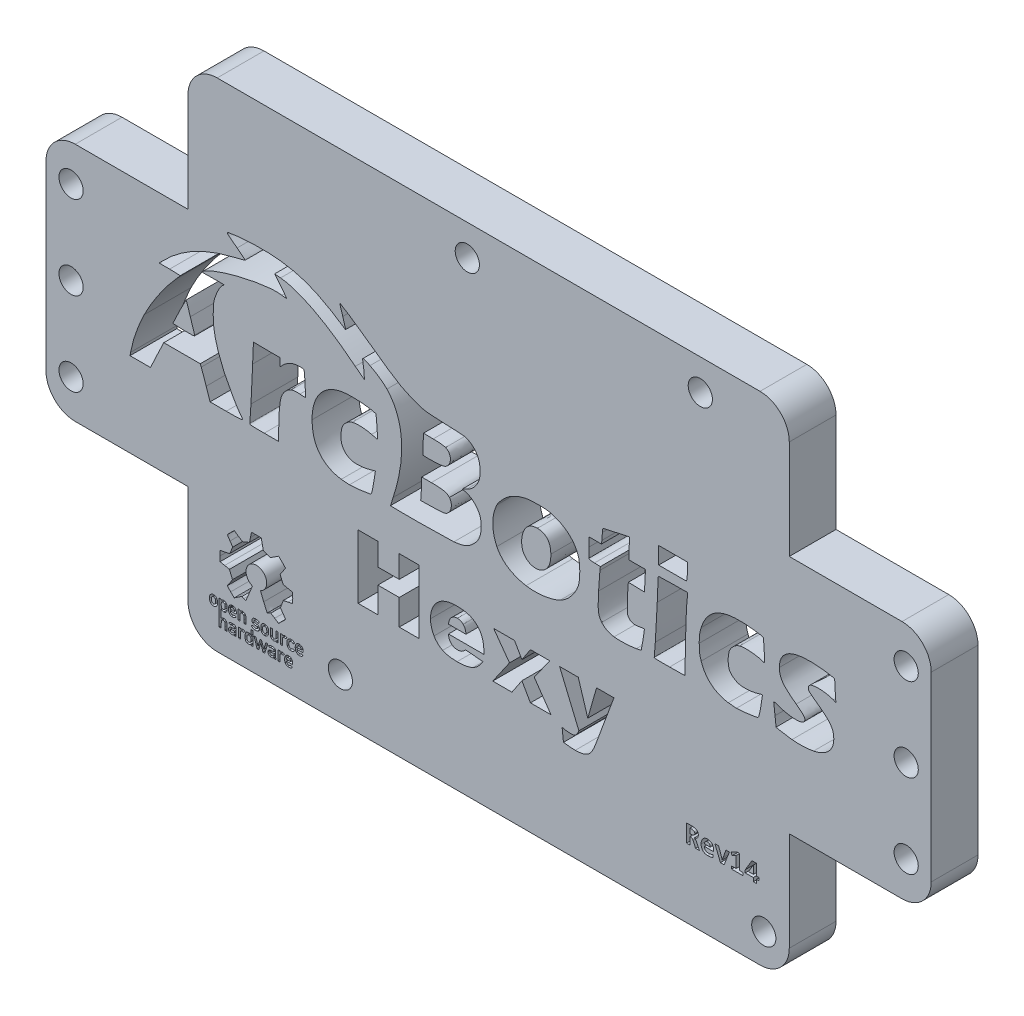
from build123d import *

# Parameters (mm, degrees)
MODEL_R                = 1.45
BOSS_EXTRUDE1_DEPTH    = 5.6
BOSS_EXTRUDE1_2_DEPTH  = 5.6
BOSS_EXTRUDE1_3_DEPTH  = 5.6
BOSS_EXTRUDE1_4_DEPTH  = 5.6
BOSS_EXTRUDE1_5_DEPTH  = 5.6
BOSS_EXTRUDE1_6_DEPTH  = 5.6
BOSS_EXTRUDE1_7_DEPTH  = 5.6
BOSS_EXTRUDE1_8_DEPTH  = 5.6
BOSS_EXTRUDE1_9_DEPTH  = 5.6
BOSS_EXTRUDE1_10_DEPTH = 5.6
BOSS_EXTRUDE1_11_DEPTH = 5.6
BOSS_EXTRUDE1_12_DEPTH = 5.6
BOSS_EXTRUDE1_13_DEPTH = 5.6
BOSS_EXTRUDE1_14_DEPTH = 5.6
BOSS_EXTRUDE1_15_DEPTH = 5.6
CUT_EXTRUDE1_DEPTH     = 5.6
FILLET1_R              = 3.5


with BuildPart() as part:
    # Model → Boss-Extrude1 (new body)
    with BuildSketch(Plane.XY):
        Polygon((653.4922175, 464.272333), (636.4922175, 464.272333), (636.4922175, 479.647333), (564.4922175, 479.647333), (564.4922175, 464.272333), (547.4922175, 464.272333), (547.4922175, 435.522333), (564.4922175, 435.522333), (564.4922175, 420.147333), (636.4922175, 420.147333), (636.4922175, 435.522333), (653.4922175, 435.522333), align=None)
        with BuildLine():
            Line((570.050639, 422.940087), (570.001778, 422.892728))
            add(Edge.make_bspline(
                [(569.902379, 422.830876), (569.930174, 422.838848), (569.974904, 422.866682), (570.001778, 422.892728)],
                knots=[0, 0, 0, 0, 1, 1, 1, 1], degree=3))
            add(Edge.make_bspline(
                [(569.589312, 422.837642), (569.65536, 422.814083), (569.830615, 422.810295), (569.902379, 422.830876)],
                knots=[0, 0, 0, 0, 1, 1, 1, 1], degree=3))
            add(Edge.make_bspline(
                [(569.381774, 423.009909), (569.422474, 422.928234), (569.488133, 422.873734), (569.589312, 422.837642)],
                knots=[0, 0, 0, 0, 1, 1, 1, 1], degree=3))
            add(Edge.make_bspline(
                [(569.436111, 423.397761), (569.334442, 423.292148), (569.313965, 423.145984), (569.381774, 423.009909)],
                knots=[0, 0, 0, 0, 1, 1, 1, 1], degree=3))
            add(Edge.make_bspline(
                [(569.854322, 423.509169), (569.604094, 423.509169), (569.522411, 423.487409), (569.436111, 423.397761)],
                knots=[0, 0, 0, 0, 1, 1, 1, 1], degree=3))
            Line((569.854322, 423.509169), (570.050639, 423.509169))
            Line((570.050639, 423.509169), (570.050639, 423.595622))
            add(Edge.make_bspline(
                [(569.775102, 423.785832), (569.97499, 423.79866), (570.050639, 423.746437), (570.050639, 423.595622)],
                knots=[0, 0, 0, 0, 1, 1, 1, 1], degree=3))
            add(Edge.make_bspline(
                [(569.622945, 423.747172), (569.654611, 423.770584), (569.694183, 423.780638), (569.775102, 423.785832)],
                knots=[0, 0, 0, 0, 1, 1, 1, 1], degree=3))
            add(Edge.make_bspline(
                [(569.622945, 423.747172), (569.599406, 423.72977), (569.576278, 423.715531), (569.566819, 423.715531), (569.525879, 423.743519), (569.480572, 423.777726)],
                knots=[0, 0, 0, 0, 1, 1, 2.000211461, 2.000211461, 2.000211461, 2.000211461], degree=3))
            Line((569.480572, 423.777726), (569.398195, 423.839922))
            Line((569.398195, 423.839922), (569.459637, 423.894447))
            add(Edge.make_bspline(
                [(569.459637, 423.894447), (569.545558, 423.970696), (569.629425, 423.995594), (570.038572, 423.995594), (570.17261, 423.935194), (570.235864, 423.799338)],
                knots=[0, 0, 0, 0, 1, 1, 2.393876452, 2.393876452, 2.393876452, 2.393876452], degree=3))
            add(Edge.make_bspline(
                [(570.271597, 423.277012), (570.271455, 423.717333), (570.271008, 423.723856), (570.235864, 423.799338)],
                knots=[0, 0, 0, 0, 1, 1, 1, 1], degree=3))
            Line((570.271597, 423.277012), (570.271741, 422.831123))
            Line((570.271741, 422.831123), (570.050639, 422.831123))
            Line((570.050639, 422.831123), (570.050639, 422.940087))
        make_face(mode=Mode.SUBTRACT)
        with BuildLine():
            Line((570.537063, 422.831123), (570.537063, 423.995594))
            Line((570.537063, 423.995594), (570.772906, 423.995594))
            Line((570.772906, 423.995594), (570.772906, 423.859879))
            Line((570.772906, 423.859879), (570.827109, 423.90747))
            add(Edge.make_bspline(
                [(570.827109, 423.90747), (570.902921, 423.974034), (570.963303, 423.995594), (571.166405, 423.995594), (571.215662, 423.98244), (571.285057, 423.93921)],
                knots=[0, 0, 0, 0, 1, 1, 1.836215859, 1.836215859, 1.836215859, 1.836215859], degree=3))
            Line((571.285057, 423.93921), (571.318154, 423.918592))
            Line((571.318154, 423.918592), (571.274748, 423.864967))
            add(Edge.make_bspline(
                [(571.19592, 423.768096), (571.215402, 423.791881), (571.250875, 423.835474), (571.274748, 423.864967)],
                knots=[0, 0, 0, 0, 1, 1, 1, 1], degree=3))
            Line((571.19592, 423.768096), (571.160497, 423.724849))
            Line((571.160497, 423.724849), (571.104658, 423.751346))
            add(Edge.make_bspline(
                [(570.863934, 423.734967), (570.920602, 423.776496), (571.035225, 423.784295), (571.104658, 423.751346)],
                knots=[0, 0, 0, 0, 1, 1, 1, 1], degree=3))
            add(Edge.make_bspline(
                [(570.772929, 423.218051), (570.772954, 423.641871), (570.778294, 423.672207), (570.863934, 423.734967)],
                knots=[0, 0, 0, 0, 1, 1, 1, 1], degree=3))
            Line((570.772929, 423.218051), (570.772906, 422.831123))
            Line((570.772906, 422.831123), (570.537063, 422.831123))
        make_face(mode=Mode.SUBTRACT)
        with BuildLine():
            Line((572.040558, 422.952543), (571.989061, 422.913264))
            add(Edge.make_bspline(
                [(571.57528, 422.844247), (571.6983, 422.788372), (571.86087, 422.815488), (571.989061, 422.913264)],
                knots=[0, 0, 0, 0, 1, 1, 1, 1], degree=3))
            add(Edge.make_bspline(
                [(571.375892, 423.041062), (571.41432, 422.954902), (571.484778, 422.885353), (571.57528, 422.844247)],
                knots=[0, 0, 0, 0, 1, 1, 1, 1], degree=3))
            add(Edge.make_bspline(
                [(571.340916, 423.398618), (571.341302, 423.137176), (571.343628, 423.113403), (571.375892, 423.041062)],
                knots=[0, 0, 0, 0, 1, 1, 1, 1], degree=3))
            add(Edge.make_bspline(
                [(571.436392, 423.867008), (571.350372, 423.769285), (571.34044, 423.720561), (571.340916, 423.398618)],
                knots=[0, 0, 0, 0, 1, 1, 1, 1], degree=3))
            add(Edge.make_bspline(
                [(571.436392, 423.867008), (571.517926, 423.959636), (571.597659, 423.995594), (571.825913, 423.995594), (571.895157, 423.970135), (571.992653, 423.895907)],
                knots=[0, 0, 0, 0, 1, 1, 1.842883325, 1.842883325, 1.842883325, 1.842883325], degree=3))
            Line((571.992653, 423.895907), (572.040558, 423.859434))
            Line((572.040558, 423.859434), (572.040558, 424.467279))
            Line((572.040558, 424.467279), (572.26166, 424.467279))
            Line((572.26166, 424.467279), (572.26166, 422.831123))
            Line((572.26166, 422.831123), (572.040558, 422.831123))
            Line((572.040558, 422.831123), (572.040558, 422.952543))
        make_face(mode=Mode.SUBTRACT)
        with BuildLine():
            Line((572.76845, 422.829935), (572.61588, 423.305894))
            add(Edge.make_bspline(
                [(572.429778, 423.889308), (572.448221, 423.830213), (572.531967, 423.56768), (572.61588, 423.305894)],
                knots=[0, 0, 0, 0, 1, 1, 1, 1], degree=3))
            Line((572.429778, 423.889308), (572.396246, 423.996755))
            Line((572.396246, 423.996755), (572.516668, 423.992489))
            Line((572.516668, 423.992489), (572.63709, 423.988224))
            Line((572.63709, 423.988224), (572.747863, 423.587415))
            add(Edge.make_bspline(
                [(572.866472, 423.179138), (572.862162, 423.183245), (572.808788, 423.36697), (572.747863, 423.587415)],
                knots=[0, 0, 0, 0, 1, 1, 1, 1], degree=3))
            add(Edge.make_bspline(
                [(573.006503, 423.58348), (572.933795, 423.356985), (572.870781, 423.175032), (572.866472, 423.179138)],
                knots=[0, 0, 0, 0, 1, 1, 1, 1], degree=3))
            Line((573.006503, 423.58348), (573.138699, 423.99529))
            Line((573.138699, 423.99529), (573.21977, 423.995378))
            Line((573.21977, 423.995378), (573.30084, 423.995466))
            Line((573.30084, 423.995466), (573.43346, 423.582802))
            add(Edge.make_bspline(
                [(573.573491, 423.170196), (573.569414, 423.170163), (573.5064, 423.355836), (573.43346, 423.582802)],
                knots=[0, 0, 0, 0, 1, 1, 1, 1], degree=3))
            add(Edge.make_bspline(
                [(573.573491, 423.170196), (573.577568, 423.170226), (573.630362, 423.353372), (573.75126, 423.800988), (573.808262, 423.986999), (573.817481, 423.990537)],
                knots=[0, 0, 0, 0, 1, 1, 2, 2, 2, 2], degree=3))
            add(Edge.make_bspline(
                [(573.938392, 423.992592), (573.881111, 423.994999), (573.826701, 423.994074), (573.817481, 423.990537)],
                knots=[0, 0, 0, 0, 1, 1, 1, 1], degree=3))
            Line((573.938392, 423.992592), (574.042539, 423.988214))
            Line((574.042539, 423.988214), (573.881557, 423.48705))
            add(Edge.make_bspline(
                [(573.697418, 422.907878), (573.710155, 422.950782), (573.793017, 423.211409), (573.881557, 423.48705)],
                knots=[0, 0, 0, 0, 1, 1, 1, 1], degree=3))
            Line((573.697418, 422.907878), (573.674261, 422.829871))
            Line((573.674261, 422.829871), (573.466317, 422.838483))
            Line((573.466317, 422.838483), (573.347284, 423.240152))
            add(Edge.make_bspline(
                [(573.220326, 423.641816), (573.224685, 423.641819), (573.281816, 423.46107), (573.347284, 423.240152)],
                knots=[0, 0, 0, 0, 1, 1, 1, 1], degree=3))
            add(Edge.make_bspline(
                [(573.093046, 423.240148), (573.15869, 423.461063), (573.215966, 423.641814), (573.220326, 423.641816)],
                knots=[0, 0, 0, 0, 1, 1, 1, 1], degree=3))
            Line((573.093046, 423.240148), (572.973692, 422.838483))
            Line((572.973692, 422.838483), (572.871071, 422.834209))
            Line((572.871071, 422.834209), (572.76845, 422.829935))
        make_face(mode=Mode.SUBTRACT)
        with BuildLine():
            Line((568.237601, 422.831123), (568.237601, 425.838112))
            Line((568.237601, 425.838112), (568.473443, 425.838112))
            Line((568.473443, 425.838112), (568.473443, 425.722184))
            Line((568.473443, 425.722184), (568.54791, 425.772297))
            add(Edge.make_bspline(
                [(568.895191, 425.831074), (568.76352, 425.870176), (568.669783, 425.854311), (568.54791, 425.772297)],
                knots=[0, 0, 0, 0, 1, 1, 1, 1], degree=3))
            add(Edge.make_bspline(
                [(569.124399, 425.635395), (569.080274, 425.724994), (568.988462, 425.803375), (568.895191, 425.831074)],
                knots=[0, 0, 0, 0, 1, 1, 1, 1], degree=3))
            add(Edge.make_bspline(
                [(569.124399, 425.635395), (569.157205, 425.56878), (569.15886, 425.550552), (569.15886, 424.961201), (569.157205, 424.942972), (569.124399, 424.876357)],
                knots=[0, 0, 0, 0, 1, 1, 1.999996606, 1.999996606, 1.999996606, 1.999996606], degree=3))
            add(Edge.make_bspline(
                [(569.124399, 424.876357), (569.062181, 424.750019), (568.91498, 424.6589), (568.708795, 424.6589), (568.593225, 424.703699), (568.526774, 424.754383)],
                knots=[0, 0, 0, 0, 1, 1, 1.453224886, 1.453224886, 1.453224886, 1.453224886], degree=3))
            Line((568.526774, 424.754383), (568.473443, 424.795061))
            Line((568.473443, 424.795061), (568.473443, 423.86434))
            Line((568.473443, 423.86434), (568.513979, 423.902485))
            add(Edge.make_bspline(
                [(568.513979, 423.902485), (568.582306, 423.966781), (568.662004, 423.994947), (568.935759, 423.994947), (569.05027, 423.925735), (569.126877, 423.782642)],
                knots=[0, 0, 0, 0, 1, 1, 2.40956061, 2.40956061, 2.40956061, 2.40956061], degree=3))
            add(Edge.make_bspline(
                [(569.163342, 423.277012), (569.159072, 423.701785), (569.157345, 423.72573), (569.126877, 423.782642)],
                knots=[0, 0, 0, 0, 1, 1, 1, 1], degree=3))
            Line((569.163342, 423.277012), (569.167824, 422.831123))
            Line((569.167824, 422.831123), (568.946913, 422.831123))
            Line((568.946913, 422.831123), (568.942335, 423.218051))
            add(Edge.make_bspline(
                [(568.908278, 423.65503), (568.935377, 423.609023), (568.938128, 423.573726), (568.942335, 423.218051)],
                knots=[0, 0, 0, 0, 1, 1, 1, 1], degree=3))
            add(Edge.make_bspline(
                [(568.908278, 423.65503), (568.858649, 423.739286), (568.80805, 423.767122), (568.633944, 423.767122), (568.603113, 423.759731), (568.567387, 423.734247)],
                knots=[0, 0, 0, 0, 1, 1, 1.681696127, 1.681696127, 1.681696127, 1.681696127], degree=3))
            add(Edge.make_bspline(
                [(568.473443, 423.215824), (568.473443, 423.641905), (568.478715, 423.670997), (568.567387, 423.734247)],
                knots=[0, 0, 0, 0, 1, 1, 1, 1], degree=3))
            Line((568.473443, 423.215824), (568.473443, 422.831123))
            Line((568.473443, 422.831123), (568.237601, 422.831123))
        make_face(mode=Mode.SUBTRACT)
        with BuildLine():
            add(Edge.make_bspline(
                [(567.419523, 424.679519), (567.605599, 424.620671), (567.824121, 424.693717), (567.938622, 424.85304)],
                knots=[0, 0, 0, 0, 1, 1, 1, 1], degree=3))
            add(Edge.make_bspline(
                [(567.200261, 424.822108), (567.271638, 424.742721), (567.320826, 424.710733), (567.419523, 424.679519)],
                knots=[0, 0, 0, 0, 1, 1, 1, 1], degree=3))
            add(Edge.make_bspline(
                [(567.200261, 424.822108), (567.104452, 424.928672), (567.081237, 425.013274), (567.081237, 425.502996), (567.10421, 425.584129), (567.205592, 425.695057)],
                knots=[0, 0, 0, 0, 1, 1, 2.018623095, 2.018623095, 2.018623095, 2.018623095], degree=3))
            add(Edge.make_bspline(
                [(567.552184, 425.844608), (567.396519, 425.843454), (567.305211, 425.804055), (567.205592, 425.695057)],
                knots=[0, 0, 0, 0, 1, 1, 1, 1], degree=3))
            add(Edge.make_bspline(
                [(567.835513, 425.761336), (567.734766, 425.82931), (567.679505, 425.845551), (567.552184, 425.844608)],
                knots=[0, 0, 0, 0, 1, 1, 1, 1], degree=3))
            add(Edge.make_bspline(
                [(567.835513, 425.761336), (567.974184, 425.667774), (568.031239, 425.520431), (568.031239, 425.060638), (568.004625, 424.944878), (567.938622, 424.85304)],
                knots=[0, 0, 0, 0, 1, 1, 1.73798643, 1.73798643, 1.73798643, 1.73798643], degree=3))
        make_face(mode=Mode.SUBTRACT)
        with BuildLine():
            Line((569.564214, 425.174805), (569.564214, 425.125533))
            add(Edge.make_bspline(
                [(569.690611, 424.91341), (569.623501, 424.9516), (569.564214, 425.051097), (569.564214, 425.125533)],
                knots=[0, 0, 0, 0, 1, 1, 1, 1], degree=3))
            add(Edge.make_bspline(
                [(570.080813, 424.961701), (569.989325, 424.878906), (569.793774, 424.854705), (569.690611, 424.91341)],
                knots=[0, 0, 0, 0, 1, 1, 1, 1], degree=3))
            add(Edge.make_bspline(
                [(570.179731, 424.920355), (570.113069, 424.975445), (570.101393, 424.980326), (570.080813, 424.961701)],
                knots=[0, 0, 0, 0, 1, 1, 1, 1], degree=3))
            add(Edge.make_bspline(
                [(570.256158, 424.847434), (570.255694, 424.853186), (570.221302, 424.886001), (570.179731, 424.920355)],
                knots=[0, 0, 0, 0, 1, 1, 1, 1], degree=3))
            add(Edge.make_bspline(
                [(570.084448, 424.715208), (570.170214, 424.756219), (570.258058, 424.823863), (570.256158, 424.847434)],
                knots=[0, 0, 0, 0, 1, 1, 1, 1], degree=3))
            add(Edge.make_bspline(
                [(569.716682, 424.673321), (569.829147, 424.649362), (569.983513, 424.666944), (570.084448, 424.715208)],
                knots=[0, 0, 0, 0, 1, 1, 1, 1], degree=3))
            add(Edge.make_bspline(
                [(569.344378, 425.369907), (569.298463, 425.00269), (569.443384, 424.731541), (569.716682, 424.673321)],
                knots=[0, 0, 0, 0, 1, 1, 1, 1], degree=3))
            add(Edge.make_bspline(
                [(569.815106, 425.845177), (569.554167, 425.844459), (569.381976, 425.670607), (569.344378, 425.369907)],
                knots=[0, 0, 0, 0, 1, 1, 1, 1], degree=3))
            add(Edge.make_bspline(
                [(570.024535, 425.796957), (569.939245, 425.838946), (569.911034, 425.845441), (569.815106, 425.845177)],
                knots=[0, 0, 0, 0, 1, 1, 1, 1], degree=3))
            add(Edge.make_bspline(
                [(570.286481, 425.321654), (570.286481, 425.569179), (570.211741, 425.704796), (570.024535, 425.796957)],
                knots=[0, 0, 0, 0, 1, 1, 1, 1], degree=3))
            Line((570.286481, 425.321654), (570.286481, 425.174805))
            Line((570.286481, 425.174805), (569.564214, 425.174805))
        make_face(mode=Mode.SUBTRACT)
        with BuildLine():
            Line((570.507583, 424.673641), (570.507583, 425.838112))
            Line((570.507583, 425.838112), (570.728685, 425.838112))
            Line((570.728685, 425.838112), (570.728685, 425.699668))
            Line((570.728685, 425.699668), (570.776591, 425.745129))
            add(Edge.make_bspline(
                [(571.386483, 425.625199), (571.276115, 425.862218), (570.964536, 425.923487), (570.776591, 425.745129)],
                knots=[0, 0, 0, 0, 1, 1, 1, 1], degree=3))
            add(Edge.make_bspline(
                [(571.421328, 425.11216), (571.421187, 425.541589), (571.420465, 425.552224), (571.386483, 425.625199)],
                knots=[0, 0, 0, 0, 1, 1, 1, 1], degree=3))
            Line((571.421328, 425.11216), (571.421472, 424.673641))
            Line((571.421472, 424.673641), (571.20037, 424.673641))
            Line((571.20037, 424.673641), (571.200046, 425.053199))
            add(Edge.make_bspline(
                [(571.171422, 425.495099), (571.19695, 425.438863), (571.199754, 425.395585), (571.200046, 425.053199)],
                knots=[0, 0, 0, 0, 1, 1, 1, 1], degree=3))
            add(Edge.make_bspline(
                [(571.171422, 425.495099), (571.133455, 425.578738), (571.068632, 425.616899), (570.860422, 425.616899), (570.7956, 425.578738), (570.757632, 425.495099)],
                knots=[0, 0, 0, 0, 1, 1, 2, 2, 2, 2], degree=3))
            add(Edge.make_bspline(
                [(570.729008, 425.053199), (570.7293, 425.395585), (570.732104, 425.438863), (570.757632, 425.495099)],
                knots=[0, 0, 0, 0, 1, 1, 1, 1], degree=3))
            Line((570.729008, 425.053199), (570.728685, 424.673641))
            Line((570.728685, 424.673641), (570.507583, 424.673641))
        make_face(mode=Mode.SUBTRACT)
        with BuildLine():
            Line((572.893323, 425.532576), (572.809649, 425.578478))
            add(Edge.make_bspline(
                [(572.809649, 425.578478), (572.733174, 425.62043), (572.714348, 425.62438), (572.468146, 425.62438), (572.452234, 425.621097), (572.417657, 425.588645)],
                knots=[0, 0, 0, 0, 1, 1, 1.993619175, 1.993619175, 1.993619175, 1.993619175], degree=3))
            add(Edge.make_bspline(
                [(572.417657, 425.588645), (572.390122, 425.562803), (572.379581, 425.537932), (572.379581, 425.417066), (572.414492, 425.394737), (572.566951, 425.378963)],
                knots=[0, 0, 0, 0, 1, 1, 3.088989982, 3.088989982, 3.088989982, 3.088989982], degree=3))
            add(Edge.make_bspline(
                [(573.009271, 425.216784), (572.938856, 425.323187), (572.873139, 425.347283), (572.566951, 425.378963)],
                knots=[0, 0, 0, 0, 1, 1, 1, 1], degree=3))
            add(Edge.make_bspline(
                [(573.030411, 424.88444), (573.074186, 424.970245), (573.063739, 425.134477), (573.009271, 425.216784)],
                knots=[0, 0, 0, 0, 1, 1, 1, 1], degree=3))
            add(Edge.make_bspline(
                [(572.803301, 424.696802), (572.897497, 424.727864), (572.989173, 424.803606), (573.030411, 424.88444)],
                knots=[0, 0, 0, 0, 1, 1, 1, 1], degree=3))
            add(Edge.make_bspline(
                [(572.468022, 424.667846), (572.537559, 424.65504), (572.726011, 424.671315), (572.803301, 424.696802)],
                knots=[0, 0, 0, 0, 1, 1, 1, 1], degree=3))
            add(Edge.make_bspline(
                [(572.090243, 424.853605), (572.122391, 424.801589), (572.350289, 424.689528), (572.468022, 424.667846)],
                knots=[0, 0, 0, 0, 1, 1, 1, 1], degree=3))
            add(Edge.make_bspline(
                [(572.154619, 424.942122), (572.114141, 424.901644), (572.085172, 424.861811), (572.090243, 424.853605)],
                knots=[0, 0, 0, 0, 1, 1, 1, 1], degree=3))
            Line((572.154619, 424.942122), (572.228217, 425.01572))
            Line((572.228217, 425.01572), (572.290223, 424.970802))
            add(Edge.make_bspline(
                [(572.615425, 424.882236), (572.48029, 424.876099), (572.385212, 424.901993), (572.290223, 424.970802)],
                knots=[0, 0, 0, 0, 1, 1, 1, 1], degree=3))
            add(Edge.make_bspline(
                [(572.828316, 424.988374), (572.803093, 424.917552), (572.743964, 424.888073), (572.615425, 424.882236)],
                knots=[0, 0, 0, 0, 1, 1, 1, 1], degree=3))
            add(Edge.make_bspline(
                [(572.777222, 425.125381), (572.823449, 425.103887), (572.846982, 425.040783), (572.828316, 424.988374)],
                knots=[0, 0, 0, 0, 1, 1, 1, 1], degree=3))
            add(Edge.make_bspline(
                [(572.574019, 425.158276), (572.665702, 425.14952), (572.757143, 425.134718), (572.777222, 425.125381)],
                knots=[0, 0, 0, 0, 1, 1, 1, 1], degree=3))
            add(Edge.make_bspline(
                [(572.242205, 425.260124), (572.301299, 425.206686), (572.407073, 425.174219), (572.574019, 425.158276)],
                knots=[0, 0, 0, 0, 1, 1, 1, 1], degree=3))
            add(Edge.make_bspline(
                [(572.19151, 425.663413), (572.120782, 425.542725), (572.14529, 425.347766), (572.242205, 425.260124)],
                knots=[0, 0, 0, 0, 1, 1, 1, 1], degree=3))
            add(Edge.make_bspline(
                [(572.286523, 425.768452), (572.255609, 425.7471), (572.212853, 425.699832), (572.19151, 425.663413)],
                knots=[0, 0, 0, 0, 1, 1, 1, 1], degree=3))
            add(Edge.make_bspline(
                [(572.286523, 425.768452), (572.350603, 425.812711), (572.489689, 425.852852), (572.722, 425.852852), (572.901305, 425.796781), (572.99739, 425.722005)],
                knots=[0, 0, 0, 0, 1, 1, 2.602224612, 2.602224612, 2.602224612, 2.602224612], degree=3))
            Line((572.99739, 425.722005), (573.032964, 425.694321))
            Line((573.032964, 425.694321), (572.963143, 425.613448))
            Line((572.963143, 425.613448), (572.893323, 425.532576))
        make_face(mode=Mode.SUBTRACT)
        with BuildLine():
            Line((573.212399, 425.019414), (573.212632, 425.255566))
            add(Edge.make_bspline(
                [(573.304417, 425.666198), (573.220655, 425.544918), (573.212883, 425.510146), (573.212632, 425.255566)],
                knots=[0, 0, 0, 0, 1, 1, 1, 1], degree=3))
            add(Edge.make_bspline(
                [(573.88293, 425.807289), (573.675676, 425.896448), (573.420448, 425.834201), (573.304417, 425.666198)],
                knots=[0, 0, 0, 0, 1, 1, 1, 1], degree=3))
            add(Edge.make_bspline(
                [(574.127697, 425.542915), (574.091922, 425.645724), (573.981664, 425.764815), (573.88293, 425.807289)],
                knots=[0, 0, 0, 0, 1, 1, 1, 1], degree=3))
            add(Edge.make_bspline(
                [(574.121729, 424.953076), (574.166813, 425.067748), (574.17038, 425.42025), (574.127697, 425.542915)],
                knots=[0, 0, 0, 0, 1, 1, 1, 1], degree=3))
            add(Edge.make_bspline(
                [(573.707582, 424.664777), (573.893643, 424.67358), (574.056383, 424.786867), (574.121729, 424.953076)],
                knots=[0, 0, 0, 0, 1, 1, 1, 1], degree=3))
            add(Edge.make_bspline(
                [(573.566163, 424.671744), (573.590485, 424.665383), (573.654123, 424.662248), (573.707582, 424.664777)],
                knots=[0, 0, 0, 0, 1, 1, 1, 1], degree=3))
            add(Edge.make_bspline(
                [(573.26097, 424.920753), (573.324824, 424.791047), (573.426165, 424.708363), (573.566163, 424.671744)],
                knots=[0, 0, 0, 0, 1, 1, 1, 1], degree=3))
            Line((573.26097, 424.920753), (573.212399, 425.019414))
        make_face(mode=Mode.SUBTRACT)
        with BuildLine():
            add(Edge.make_bspline(
                [(569.484746954, 431.069945528), (569.466642954, 431.052661528), (569.300516954, 431.016155528), (568.928292954, 430.947667528)],
                knots=[0, 0, 0, 0, 1, 1, 1, 1], degree=3))
            Line((569.484746954, 431.069945528), (569.849551954, 431.909892528))
            add(Edge.make_bspline(
                [(569.531065954, 432.398939528), (569.706232954, 432.143949528), (569.849551954, 431.923878528), (569.849551954, 431.909892528)],
                knots=[0, 0, 0, 0, 1, 1, 1, 1], degree=3))
            add(Edge.make_bspline(
                [(569.204648954, 432.882434528), (569.209011954, 432.871501528), (569.355899954, 432.653928528), (569.531065954, 432.398939528)],
                knots=[0, 0, 0, 0, 1, 1, 1, 1], degree=3))
            add(Edge.make_bspline(
                [(569.204648954, 432.882434528), (569.195895954, 432.904367528), (570.006430954, 433.724854528), (570.046741954, 433.724854528), (570.267129954, 433.578927528), (570.526601954, 433.400571528)],
                knots=[0, 0, 0, 0, 1, 1, 1.325147929, 1.325147929, 1.325147929, 1.325147929], degree=3))
            add(Edge.make_bspline(
                [(571.040253954, 433.076288528), (571.009799954, 433.076288528), (570.869624954, 433.164785528), (570.526601954, 433.400571528)],
                knots=[0, 0, 0, 0, 1, 1, 1, 1], degree=3))
            Line((571.040253954, 433.076288528), (571.853586954, 433.410003528))
            add(Edge.make_bspline(
                [(571.979291954, 433.982807528), (571.907193954, 433.590201528), (571.871979954, 433.429741528), (571.853586954, 433.410003528)],
                knots=[0, 0, 0, 0, 1, 1, 1, 1], degree=3))
            add(Edge.make_bspline(
                [(572.091754954, 434.561358528), (572.084985954, 434.543117528), (572.034376954, 434.282769528), (571.979291954, 433.982807528)],
                knots=[0, 0, 0, 0, 1, 1, 1, 1], degree=3))
            Line((572.091754954, 434.561358528), (572.104063954, 434.594523528))
            Line((572.104063954, 434.594523528), (572.68052, 434.593757))
            add(Edge.make_bspline(
                [(573.274144, 434.575332), (573.264959, 434.58956), (573.129734, 434.593757), (572.68052, 434.593757)],
                knots=[0, 0, 0, 0, 1, 1, 1, 1], degree=3))
            add(Edge.make_bspline(
                [(573.391974, 433.990898), (573.333709, 434.302203), (573.280685, 434.565198), (573.274144, 434.575332)],
                knots=[0, 0, 0, 0, 1, 1, 1, 1], degree=3))
            add(Edge.make_bspline(
                [(573.518258, 433.404543), (573.50635, 433.416451), (573.453973, 433.659646), (573.391974, 433.990898)],
                knots=[0, 0, 0, 0, 1, 1, 1, 1], degree=3))
            Line((573.518258, 433.404543), (574.332894, 433.075522))
            add(Edge.make_bspline(
                [(574.837953, 433.39446), (574.513367, 433.171882), (574.360776, 433.075522), (574.332894, 433.075522)],
                knots=[0, 0, 0, 0, 1, 1, 1, 1], degree=3))
            add(Edge.make_bspline(
                [(575.331554, 433.720849), (575.315882, 433.716751), (575.093761, 433.569875), (574.837953, 433.39446)],
                knots=[0, 0, 0, 0, 1, 1, 1, 1], degree=3))
            add(Edge.make_bspline(
                [(575.763924, 433.324626), (575.452027, 433.636368), (575.353559, 433.726603), (575.331554, 433.720849)],
                knots=[0, 0, 0, 0, 1, 1, 1, 1], degree=3))
            add(Edge.make_bspline(
                [(575.763924, 433.324626), (575.986055, 433.102605), (576.167798, 432.910585), (576.167798, 432.885244), (576.02535, 432.667071), (575.851247, 432.413086)],
                knots=[0, 0, 0, 0, 1, 1, 1.99992108, 1.99992108, 1.99992108, 1.99992108], degree=3))
            add(Edge.make_bspline(
                [(575.526199, 431.924522), (575.530873, 431.939248), (575.677145, 432.159101), (575.851247, 432.413086)],
                knots=[0, 0, 0, 0, 1, 1, 1, 1], degree=3))
            Line((575.526199, 431.924522), (575.885481, 431.068859))
            add(Edge.make_bspline(
                [(576.455231, 430.944765), (576.075073, 431.014455), (575.902464, 431.05205), (575.885481, 431.068859)],
                knots=[0, 0, 0, 0, 1, 1, 1, 1], degree=3))
            add(Edge.make_bspline(
                [(577.019041, 430.830728), (577.008908, 430.83846), (576.755193, 430.889777), (576.455231, 430.944765)],
                knots=[0, 0, 0, 0, 1, 1, 1, 1], degree=3))
            add(Edge.make_bspline(
                [(577.020864, 429.647288), (577.045998, 429.662821), (577.044229, 430.811511), (577.019041, 430.830728)],
                knots=[0, 0, 0, 0, 1, 1, 1, 1], degree=3))
            add(Edge.make_bspline(
                [(576.465796, 429.536713), (576.761952, 429.591885), (577.011732, 429.641644), (577.020864, 429.647288)],
                knots=[0, 0, 0, 0, 1, 1, 1, 1], degree=3))
            add(Edge.make_bspline(
                [(575.908507, 429.417127), (575.91886, 429.427726), (576.16964, 429.48154), (576.465796, 429.536713)],
                knots=[0, 0, 0, 0, 1, 1, 1, 1], degree=3))
            Line((575.908507, 429.417127), (575.565123006, 428.500829247))
            add(Edge.make_bspline(
                [(575.876315006, 428.037504247), (575.713105006, 428.274957247), (575.573069006, 428.483454247), (575.565123006, 428.500829247)],
                knots=[0, 0, 0, 0, 1, 1, 1, 1], degree=3))
            add(Edge.make_bspline(
                [(575.876315006, 428.037504247), (576.039526006, 427.800050247), (576.173061006, 427.597698247), (576.173061006, 427.557474247), (575.352557006, 426.746932247), (575.330641006, 426.755639247)],
                knots=[0, 0, 0, 0, 1, 1, 4.076619033, 4.076619033, 4.076619033, 4.076619033], degree=3))
            add(Edge.make_bspline(
                [(575.330641006, 426.755639247), (575.319708006, 426.759982247), (575.116738006, 426.896920247), (574.642454006, 427.222972247), (574.434703006, 427.356357247), (574.401152006, 427.356357247), (574.301207006, 427.309925247), (574.195828006, 427.253176247)],
                knots=[0, 0, 0, 0, 1, 1, 2, 2, 3.000059613, 3.000059613, 3.000059613, 3.000059613], degree=3))
            add(Edge.make_bspline(
                [(573.978876693, 427.150619748), (573.992656636, 427.150580055), (574.090284976, 427.196730029), (574.195828006, 427.253176247)],
                knots=[0, 0, 0, 0, 1, 1, 1, 1], degree=3))
            add(Edge.make_bspline(
                [(573.560281217, 428.103127435), (573.862769993, 427.371002272), (573.959617694, 427.150625805), (573.978876693, 427.150619748)],
                knots=[0, 0, 0, 0, 1, 1, 1, 1], degree=3))
            add(Edge.make_bspline(
                [(573.177314217, 429.074490435), (573.170933217, 429.063346435), (573.329116217, 428.662129435), (573.560281217, 428.103127435)],
                knots=[0, 0, 0, 0, 1, 1, 1, 1], degree=3))
            ThreePointArc((573.177314217, 429.074490435), (572.667348576, 431.451839299), (572.207974954, 429.064198528))
            add(Edge.make_bspline(
                [(571.823021954, 428.117353528), (572.034745954, 428.628716528), (572.207974954, 429.054796528), (572.207974954, 429.064198528)],
                knots=[0, 0, 0, 0, 1, 1, 1, 1], degree=3))
            add(Edge.make_bspline(
                [(571.430830954, 427.169176528), (571.434811954, 427.179310528), (571.611297954, 427.605989528), (571.823021954, 428.117353528)],
                knots=[0, 0, 0, 0, 1, 1, 1, 1], degree=3))
            add(Edge.make_bspline(
                [(571.182518954, 427.253932528), (571.381503954, 427.148911528), (571.417978954, 427.136461528), (571.430830954, 427.169176528)],
                knots=[0, 0, 0, 0, 1, 1, 1, 1], degree=3))
            add(Edge.make_bspline(
                [(571.182518954, 427.253932528), (571.074993954, 427.310681528), (570.974245954, 427.357113528), (570.943020954, 427.357113528), (570.731906954, 427.221135528), (570.247076954, 426.888745528), (570.042015954, 426.752767528), (570.025586954, 426.752767528), (569.833881954, 426.937839528), (569.607790954, 427.164038528)],
                knots=[0, 0, 0, 0, 1, 1, 1.999935951, 1.999935951, 2.999871902, 2.999871902, 3.999686132, 3.999686132, 3.999686132, 3.999686132], degree=3))
            add(Edge.make_bspline(
                [(569.205094954, 427.597145528), (569.199463954, 427.582468528), (569.331489954, 427.440472528), (569.607790954, 427.164038528)],
                knots=[0, 0, 0, 0, 1, 1, 1, 1], degree=3))
            add(Edge.make_bspline(
                [(569.205094954, 427.597145528), (569.209703954, 427.609154528), (569.349958954, 427.817989528), (569.683586954, 428.304455528), (569.820070954, 428.514163528), (569.820070954, 428.527239528)],
                knots=[0, 0, 0, 0, 1, 1, 2, 2, 2, 2], degree=3))
            Line((569.820070954, 428.527239528), (569.457976954, 429.421531528))
            add(Edge.make_bspline(
                [(568.896725954, 429.539440528), (569.194004954, 429.484058528), (569.446567954, 429.430999528), (569.457976954, 429.421531528)],
                knots=[0, 0, 0, 0, 1, 1, 1, 1], degree=3))
            add(Edge.make_bspline(
                [(568.343992954, 429.659410528), (568.351496954, 429.647578528), (568.564949954, 429.601249528), (568.896725954, 429.539440528)],
                knots=[0, 0, 0, 0, 1, 1, 1, 1], degree=3))
            add(Edge.make_bspline(
                [(568.331542954, 430.250182528), (568.331666954, 429.935859528), (568.337268954, 429.670011528), (568.343992954, 429.659410528)],
                knots=[0, 0, 0, 0, 1, 1, 1, 1], degree=3))
            Line((568.331542954, 430.250182528), (568.331316954, 430.821678528))
            Line((568.331316954, 430.821678528), (568.364481954, 430.835854528))
            add(Edge.make_bspline(
                [(568.928292954, 430.947667528), (568.636437954, 430.893966528), (568.382722954, 430.843650528), (568.364481954, 430.835854528)],
                knots=[0, 0, 0, 0, 1, 1, 1, 1], degree=3))
        make_face(mode=Mode.SUBTRACT)
        with BuildLine():
            Line((574.782225, 422.939819), (574.741689, 422.900993))
            add(Edge.make_bspline(
                [(574.646352, 422.839275), (574.676493, 422.851865), (574.719395, 422.879639), (574.741689, 422.900993)],
                knots=[0, 0, 0, 0, 1, 1, 1, 1], degree=3))
            add(Edge.make_bspline(
                [(574.320898, 422.837642), (574.39829, 422.810036), (574.578521, 422.81094), (574.646352, 422.839275)],
                knots=[0, 0, 0, 0, 1, 1, 1, 1], degree=3))
            add(Edge.make_bspline(
                [(574.074842, 423.166934), (574.075129, 423.01146), (574.162896, 422.894003), (574.320898, 422.837642)],
                knots=[0, 0, 0, 0, 1, 1, 1, 1], degree=3))
            add(Edge.make_bspline(
                [(574.25895, 423.469776), (574.137355, 423.404591), (574.074593, 423.301354), (574.074842, 423.166934)],
                knots=[0, 0, 0, 0, 1, 1, 1, 1], degree=3))
            add(Edge.make_bspline(
                [(574.5517, 423.506601), (574.346894, 423.502031), (574.310601, 423.497466), (574.25895, 423.469776)],
                knots=[0, 0, 0, 0, 1, 1, 1, 1], degree=3))
            Line((574.5517, 423.506601), (574.78549, 423.511818))
            Line((574.78549, 423.511818), (574.779527, 423.60547))
            add(Edge.make_bspline(
                [(574.746204, 423.729354), (574.76494, 423.708652), (574.775444, 423.669602), (574.779527, 423.60547)],
                knots=[0, 0, 0, 0, 1, 1, 1, 1], degree=3))
            add(Edge.make_bspline(
                [(574.327876, 423.726046), (574.396936, 423.809322), (574.671867, 423.811496), (574.746204, 423.729354)],
                knots=[0, 0, 0, 0, 1, 1, 1, 1], degree=3))
            add(Edge.make_bspline(
                [(574.219453, 423.771557), (574.298896, 423.709864), (574.310438, 423.705019), (574.327876, 423.726046)],
                knots=[0, 0, 0, 0, 1, 1, 1, 1], degree=3))
            Line((574.219453, 423.771557), (574.130545, 423.8406))
            Line((574.130545, 423.8406), (574.191959, 423.8951))
            add(Edge.make_bspline(
                [(574.567011, 423.993442), (574.369432, 423.999714), (574.284853, 423.977536), (574.191959, 423.8951)],
                knots=[0, 0, 0, 0, 1, 1, 1, 1], degree=3))
            add(Edge.make_bspline(
                [(574.819671, 423.943755), (574.741212, 423.98388), (574.716766, 423.988688), (574.567011, 423.993442)],
                knots=[0, 0, 0, 0, 1, 1, 1, 1], degree=3))
            add(Edge.make_bspline(
                [(574.951245, 423.827051), (574.917045, 423.88234), (574.886114, 423.909774), (574.819671, 423.943755)],
                knots=[0, 0, 0, 0, 1, 1, 1, 1], degree=3))
            Line((574.951245, 423.827051), (574.995957, 423.754771))
            Line((574.995957, 423.754771), (575.004879, 422.831123))
            Line((575.004879, 422.831123), (574.782225, 422.831123))
            Line((574.782225, 422.831123), (574.782225, 422.939819))
        make_face(mode=Mode.SUBTRACT)
        with BuildLine():
            Line((575.268649, 422.831123), (575.268649, 423.995594))
            Line((575.268649, 423.995594), (575.504492, 423.995594))
            Line((575.504492, 423.995594), (575.504492, 423.85715))
            Line((575.504492, 423.85715), (575.552397, 423.903514))
            add(Edge.make_bspline(
                [(575.552397, 423.903514), (575.619729, 423.968681), (575.69405, 423.995594), (575.881121, 423.995594), (575.920525, 423.986944), (575.977417, 423.958115)],
                knots=[0, 0, 0, 0, 1, 1, 1.660919285, 1.660919285, 1.660919285, 1.660919285], degree=3))
            Line((575.977417, 423.958115), (576.051378, 423.920636))
            Line((576.051378, 423.920636), (575.975215, 423.829139))
            add(Edge.make_bspline(
                [(575.887023, 423.733061), (575.893639, 423.73558), (575.933326, 423.778815), (575.975215, 423.829139)],
                knots=[0, 0, 0, 0, 1, 1, 1, 1], degree=3))
            add(Edge.make_bspline(
                [(575.830506, 423.751486), (575.854974, 423.738833), (575.880407, 423.730542), (575.887023, 423.733061)],
                knots=[0, 0, 0, 0, 1, 1, 1, 1], degree=3))
            add(Edge.make_bspline(
                [(575.537951, 423.672816), (575.599982, 423.76567), (575.733596, 423.8016), (575.830506, 423.751486)],
                knots=[0, 0, 0, 0, 1, 1, 1, 1], degree=3))
            add(Edge.make_bspline(
                [(575.504492, 423.226927), (575.504492, 423.613883), (575.50524, 423.62385), (575.537951, 423.672816)],
                knots=[0, 0, 0, 0, 1, 1, 1, 1], degree=3))
            Line((575.504492, 423.226927), (575.504492, 422.831123))
            Line((575.504492, 422.831123), (575.268649, 422.831123))
        make_face(mode=Mode.SUBTRACT)
        with BuildLine():
            Line((576.993878, 422.997265), (576.933417, 422.942643))
            add(Edge.make_bspline(
                [(576.602632, 422.82171), (576.756269, 422.82752), (576.839787, 422.858053), (576.933417, 422.942643)],
                knots=[0, 0, 0, 0, 1, 1, 1, 1], degree=3))
            add(Edge.make_bspline(
                [(576.411011, 422.836171), (576.448159, 422.8239), (576.519048, 422.81855), (576.602632, 422.82171)],
                knots=[0, 0, 0, 0, 1, 1, 1, 1], degree=3))
            add(Edge.make_bspline(
                [(576.132571, 423.062549), (576.184333, 422.959669), (576.285057, 422.877779), (576.411011, 422.836171)],
                knots=[0, 0, 0, 0, 1, 1, 1, 1], degree=3))
            add(Edge.make_bspline(
                [(576.086882, 423.609129), (576.046626, 423.43838), (576.067177, 423.192524), (576.132571, 423.062549)],
                knots=[0, 0, 0, 0, 1, 1, 1, 1], degree=3))
            add(Edge.make_bspline(
                [(576.355889, 423.962397), (576.212143, 423.896588), (576.128874, 423.787237), (576.086882, 423.609129)],
                knots=[0, 0, 0, 0, 1, 1, 1, 1], degree=3))
            add(Edge.make_bspline(
                [(576.563526, 423.992599), (576.450852, 423.99831), (576.426639, 423.994788), (576.355889, 423.962397)],
                knots=[0, 0, 0, 0, 1, 1, 1, 1], degree=3))
            add(Edge.make_bspline(
                [(577.022726, 423.439742), (577.022726, 423.785399), (576.863245, 423.977408), (576.563526, 423.992599)],
                knots=[0, 0, 0, 0, 1, 1, 1, 1], degree=3))
            Line((577.022726, 423.439742), (577.022726, 423.317547))
            Line((577.022726, 423.317547), (576.287573, 423.317547))
            Line((576.287573, 423.317547), (576.29593, 423.262272))
            add(Edge.make_bspline(
                [(576.77312, 423.091471), (576.569844, 422.956949), (576.329062, 423.043132), (576.29593, 423.262272)],
                knots=[0, 0, 0, 0, 1, 1, 1, 1], degree=3))
            add(Edge.make_bspline(
                [(576.932329, 423.05054), (576.838559, 423.131706), (576.835217, 423.132565), (576.77312, 423.091471)],
                knots=[0, 0, 0, 0, 1, 1, 1, 1], degree=3))
            Line((576.932329, 423.05054), (576.993878, 422.997265))
        make_face(mode=Mode.SUBTRACT)
        with BuildLine():
            Line((575.062287, 424.792951), (575.005365, 424.747207))
            add(Edge.make_bspline(
                [(574.654939, 424.674953), (574.769217, 424.641833), (574.910488, 424.670961), (575.005365, 424.747207)],
                knots=[0, 0, 0, 0, 1, 1, 1, 1], degree=3))
            add(Edge.make_bspline(
                [(574.422331, 424.865262), (574.469996, 424.78026), (574.567864, 424.70019), (574.654939, 424.674953)],
                knots=[0, 0, 0, 0, 1, 1, 1, 1], degree=3))
            Line((574.422331, 424.865262), (574.376871, 424.946333))
            Line((574.376871, 424.946333), (574.372389, 425.392222))
            Line((574.372389, 425.392222), (574.367907, 425.838112))
            Line((574.367907, 425.838112), (574.590603, 425.838112))
            Line((574.590603, 425.838112), (574.590603, 425.492444))
            add(Edge.make_bspline(
                [(574.673251, 424.952174), (574.600684, 425.022509), (574.590603, 425.088411), (574.590603, 425.492444)],
                knots=[0, 0, 0, 0, 1, 1, 1, 1], degree=3))
            add(Edge.make_bspline(
                [(574.673251, 424.952174), (574.722479, 424.904461), (574.729992, 424.902113), (574.928884, 424.902113), (574.946754, 424.906563), (574.98143, 424.938963)],
                knots=[0, 0, 0, 0, 1, 1, 1.922516287, 1.922516287, 1.922516287, 1.922516287], degree=3))
            add(Edge.make_bspline(
                [(575.062287, 425.446766), (575.062287, 425.024948), (575.060336, 425.012691), (574.98143, 424.938963)],
                knots=[0, 0, 0, 0, 1, 1, 1, 1], degree=3))
            Line((575.062287, 425.446766), (575.062287, 425.838112))
            Line((575.062287, 425.838112), (575.29813, 425.838112))
            Line((575.29813, 425.838112), (575.29813, 424.673641))
            Line((575.29813, 424.673641), (575.062287, 424.673641))
            Line((575.062287, 424.673641), (575.062287, 424.792951))
        make_face(mode=Mode.SUBTRACT)
        with BuildLine():
            Line((577.259764, 424.855032), (577.19829, 424.799494))
            add(Edge.make_bspline(
                [(576.699643, 424.681378), (576.869043, 424.633846), (577.066783, 424.680685), (577.19829, 424.799494)],
                knots=[0, 0, 0, 0, 1, 1, 1, 1], degree=3))
            add(Edge.make_bspline(
                [(576.379738, 424.960626), (576.446075, 424.815362), (576.552159, 424.72276), (576.699643, 424.681378)],
                knots=[0, 0, 0, 0, 1, 1, 1, 1], degree=3))
            add(Edge.make_bspline(
                [(576.391692, 425.57794), (576.313496, 425.423786), (576.307586, 425.118623), (576.379738, 424.960626)],
                knots=[0, 0, 0, 0, 1, 1, 1, 1], degree=3))
            add(Edge.make_bspline(
                [(576.628465, 425.802499), (576.529357, 425.757211), (576.439308, 425.671807), (576.391692, 425.57794)],
                knots=[0, 0, 0, 0, 1, 1, 1, 1], degree=3))
            add(Edge.make_bspline(
                [(576.845845, 425.844711), (576.739552, 425.844599), (576.70659, 425.838198), (576.628465, 425.802499)],
                knots=[0, 0, 0, 0, 1, 1, 1, 1], degree=3))
            add(Edge.make_bspline(
                [(577.19829, 425.712258), (577.094039, 425.806442), (576.991799, 425.844866), (576.845845, 425.844711)],
                knots=[0, 0, 0, 0, 1, 1, 1, 1], degree=3))
            Line((577.19829, 425.712258), (577.259764, 425.65672))
            Line((577.259764, 425.65672), (577.218631, 425.613408))
            add(Edge.make_bspline(
                [(577.136015, 425.540283), (577.158831, 425.55668), (577.196008, 425.589586), (577.218631, 425.613408)],
                knots=[0, 0, 0, 0, 1, 1, 1, 1], degree=3))
            add(Edge.make_bspline(
                [(577.062314, 425.539906), (577.09452, 425.510482), (577.094546, 425.510482), (577.136015, 425.540283)],
                knots=[0, 0, 0, 0, 1, 1, 1, 1], degree=3))
            add(Edge.make_bspline(
                [(576.697438, 425.582847), (576.812451, 425.643667), (576.968896, 425.625256), (577.062314, 425.539906)],
                knots=[0, 0, 0, 0, 1, 1, 1, 1], degree=3))
            add(Edge.make_bspline(
                [(576.697438, 425.582847), (576.594845, 425.528594), (576.558412, 425.442908), (576.558412, 425.125828), (576.563029, 425.098714), (576.596128, 425.03438)],
                knots=[0, 0, 0, 0, 1, 1, 1.695324864, 1.695324864, 1.695324864, 1.695324864], degree=3))
            add(Edge.make_bspline(
                [(576.842892, 424.894985), (576.718007, 424.895311), (576.647058, 424.93539), (576.596128, 425.03438)],
                knots=[0, 0, 0, 0, 1, 1, 1, 1], degree=3))
            add(Edge.make_bspline(
                [(577.062314, 424.971846), (577.002308, 424.917023), (576.938681, 424.894734), (576.842892, 424.894985)],
                knots=[0, 0, 0, 0, 1, 1, 1, 1], degree=3))
            add(Edge.make_bspline(
                [(577.136015, 424.971469), (577.094546, 425.001271), (577.09452, 425.001271), (577.062314, 424.971846)],
                knots=[0, 0, 0, 0, 1, 1, 1, 1], degree=3))
            add(Edge.make_bspline(
                [(577.218631, 424.898344), (577.196008, 424.922166), (577.158831, 424.955072), (577.136015, 424.971469)],
                knots=[0, 0, 0, 0, 1, 1, 1, 1], degree=3))
            Line((577.218631, 424.898344), (577.259764, 424.855032))
        make_face(mode=Mode.SUBTRACT)
        with BuildLine():
            add(Edge.make_bspline(
                [(575.892136, 425.588126), (575.797444, 425.530389), (575.792448, 425.50563), (575.78717, 425.067939)],
                knots=[0, 0, 0, 0, 1, 1, 1, 1], degree=3))
            Line((575.78717, 425.067939), (575.782415, 424.673641))
            Line((575.782415, 424.673641), (575.563452, 424.673641))
            Line((575.563452, 424.673641), (575.563452, 425.838112))
            Line((575.563452, 425.838112), (575.784554, 425.838112))
            Line((575.784554, 425.838112), (575.784554, 425.779151))
            add(Edge.make_bspline(
                [(575.784554, 425.779151), (575.784554, 425.746723), (575.78826, 425.720191), (575.797318, 425.720191), (575.826249, 425.740463), (575.857082, 425.76524)],
                knots=[0, 0, 0, 0, 1, 1, 2, 2, 2, 2], degree=3))
            add(Edge.make_bspline(
                [(575.857082, 425.76524), (575.917543, 425.813828), (576.02627, 425.852852), (576.155054, 425.852852), (576.265619, 425.817069), (576.306203, 425.7865)],
                knots=[0, 0, 0, 0, 1, 1, 1.719091225, 1.719091225, 1.719091225, 1.719091225], degree=3))
            add(Edge.make_bspline(
                [(576.306203, 425.7865), (576.338569, 425.762122), (576.331355, 425.747482), (576.230454, 425.632774)],
                knots=[0, 0, 0, 0, 1, 1, 1, 1], degree=3))
            add(Edge.make_bspline(
                [(576.230454, 425.632774), (576.174027, 425.568626), (576.172382, 425.567907), (576.137644, 425.592239)],
                knots=[0, 0, 0, 0, 1, 1, 1, 1], degree=3))
            add(Edge.make_bspline(
                [(576.137644, 425.592239), (576.087304, 425.627498), (575.953019, 425.625248), (575.892136, 425.588126)],
                knots=[0, 0, 0, 0, 1, 1, 1, 1], degree=3))
        make_face(mode=Mode.SUBTRACT)
        with BuildLine():
            Line((578.26487, 424.842323), (578.208281, 424.792638))
            add(Edge.make_bspline(
                [(577.699732, 424.678104), (577.862612, 424.631887), (578.081289, 424.681137), (578.208281, 424.792638)],
                knots=[0, 0, 0, 0, 1, 1, 1, 1], degree=3))
            add(Edge.make_bspline(
                [(577.337722, 425.179947), (577.358738, 424.906537), (577.47817, 424.740972), (577.699732, 424.678104)],
                knots=[0, 0, 0, 0, 1, 1, 1, 1], degree=3))
            add(Edge.make_bspline(
                [(577.609655, 425.804288), (577.414995, 425.708853), (577.314757, 425.478715), (577.337722, 425.179947)],
                knots=[0, 0, 0, 0, 1, 1, 1, 1], degree=3))
            add(Edge.make_bspline(
                [(578.010316, 425.806554), (577.891296, 425.862485), (577.726461, 425.861553), (577.609655, 425.804288)],
                knots=[0, 0, 0, 0, 1, 1, 1, 1], degree=3))
            add(Edge.make_bspline(
                [(578.240593, 425.580159), (578.195163, 425.676487), (578.110985, 425.759246), (578.010316, 425.806554)],
                knots=[0, 0, 0, 0, 1, 1, 1, 1], degree=3))
            add(Edge.make_bspline(
                [(578.275495, 425.340632), (578.27537, 425.484005), (578.270644, 425.516438), (578.240593, 425.580159)],
                knots=[0, 0, 0, 0, 1, 1, 1, 1], degree=3))
            Line((578.275495, 425.340632), (578.275639, 425.174805))
            Line((578.275639, 425.174805), (577.564361, 425.174805))
            Line((577.564361, 425.174805), (577.571383, 425.101726))
            add(Edge.make_bspline(
                [(577.705854, 424.904187), (577.630929, 424.939741), (577.579719, 425.014968), (577.571383, 425.101726)],
                knots=[0, 0, 0, 0, 1, 1, 1, 1], degree=3))
            add(Edge.make_bspline(
                [(578.076774, 424.960074), (577.96892, 424.880001), (577.807937, 424.855745), (577.705854, 424.904187)],
                knots=[0, 0, 0, 0, 1, 1, 1, 1], degree=3))
            add(Edge.make_bspline(
                [(578.185626, 424.912189), (578.111998, 424.977104), (578.104284, 424.980497), (578.076774, 424.960074)],
                knots=[0, 0, 0, 0, 1, 1, 1, 1], degree=3))
            Line((578.185626, 424.912189), (578.26487, 424.842323))
        make_face(mode=Mode.SUBTRACT)
        with Locations((582.7422175, 425.147333)):
            Circle(MODEL_R, mode=Mode.SUBTRACT)
        with Locations((550.4922175, 439.897333)):
            Circle(MODEL_R, mode=Mode.SUBTRACT)
        Polygon((584.870435, 433.594915), (584.870435, 441.214915), (587.225435, 441.214915), (587.225435, 438.544915), (589.790435, 438.544915), (589.790435, 441.214915), (592.160435, 441.214915), (592.160435, 433.594915), (589.790435, 433.594915), (589.790435, 436.669915), (587.225435, 436.669915), (587.225435, 433.594915), align=None, mode=Mode.SUBTRACT)
        with BuildLine():
            Line((599.925435, 436.069915), (599.925435, 435.829915))
            Line((599.925435, 435.829915), (595.680435, 435.829915))
            add(Edge.make_bspline(
                [(595.680435, 435.829915), (595.710435, 435.499915), (595.800435, 435.244915), (595.950435, 435.079915)],
                knots=[0, 0, 0, 0, 1, 1, 1, 1], degree=3))
            add(Edge.make_bspline(
                [(595.950435, 435.079915), (596.160435, 434.839915), (596.430435, 434.719915), (596.970435, 434.719915), (597.165435, 434.764915), (597.345435, 434.869915)],
                knots=[0, 0, 0, 0, 1, 1, 1.636363636, 1.636363636, 1.636363636, 1.636363636], degree=3))
            add(Edge.make_bspline(
                [(597.345435, 434.869915), (597.465435, 434.929915), (597.585435, 435.049915), (597.720435, 435.214915)],
                knots=[0, 0, 0, 0, 1, 1, 1, 1], degree=3))
            Line((597.720435, 435.214915), (599.805435, 435.019915))
            add(Edge.make_bspline(
                [(599.805435, 435.019915), (599.490435, 434.479915), (599.100435, 434.074915), (598.200435, 433.594915), (597.555435, 433.474915), (595.995435, 433.474915), (595.410435, 433.579915), (594.990435, 433.789915)],
                knots=[0, 0, 0, 0, 1, 1, 2, 2, 2.857142857, 2.857142857, 2.857142857, 2.857142857], degree=3))
            add(Edge.make_bspline(
                [(594.990435, 433.789915), (594.570435, 433.984915), (594.225435, 434.314915), (593.685435, 435.214915), (593.535435, 435.739915), (593.535435, 437.194915), (593.805435, 437.899915), (594.360435, 438.439915)],
                knots=[0, 0, 0, 0, 1, 1, 2, 2, 3.425, 3.425, 3.425, 3.425], degree=3))
            add(Edge.make_bspline(
                [(594.360435, 438.439915), (594.900435, 438.964915), (595.665435, 439.234915), (597.435435, 439.234915), (598.065435, 439.114915), (598.965435, 438.634915), (599.325435, 438.289915), (599.805435, 437.389915), (599.925435, 436.804915), (599.925435, 436.069915)],
                knots=[0, 0, 0, 0, 1, 1, 1.787878788, 1.787878788, 2.575757576, 2.575757576, 3.363636364, 3.363636364, 3.363636364, 3.363636364], degree=3))
        make_face(mode=Mode.SUBTRACT)
        with Locations((633.4422175, 423.847333)):
            Circle(MODEL_R, mode=Mode.SUBTRACT)
        Polygon((602.995435, 436.489915), (601.090435, 439.114915), (603.595435, 439.114915), (604.480435, 437.569915), (605.500435, 439.114915), (607.825435, 439.114915), (605.950435, 436.489915), (607.960435, 433.594915), (605.500435, 433.594915), (604.480435, 435.379915), (603.280435, 433.594915), (600.985435, 433.594915), align=None, mode=Mode.SUBTRACT)
        with BuildLine():
            Line((611.300435, 433.594915), (608.990435, 439.114915))
            Line((608.990435, 439.114915), (611.225435, 439.114915))
            Line((611.225435, 439.114915), (612.365435, 435.439915))
            Line((612.365435, 435.439915), (613.415435, 439.114915))
            Line((613.415435, 439.114915), (615.500435, 439.114915))
            Line((615.500435, 439.114915), (613.310435, 433.219915))
            add(Edge.make_bspline(
                [(613.310435, 433.219915), (613.070435, 432.559915), (612.815435, 432.094915), (612.545435, 431.854915)],
                knots=[0, 0, 0, 0, 1, 1, 1, 1], degree=3))
            add(Edge.make_bspline(
                [(612.545435, 431.854915), (612.185435, 431.524915), (611.615435, 431.359915), (610.565435, 431.359915), (610.100435, 431.389915), (609.455435, 431.479915)],
                knots=[0, 0, 0, 0, 1, 1, 1.4, 1.4, 1.4, 1.4], degree=3))
            Line((609.455435, 431.479915), (609.290435, 432.964915))
            add(Edge.make_bspline(
                [(609.290435, 432.964915), (609.590435, 432.874915), (609.920435, 432.814915), (610.550435, 432.814915), (610.760435, 432.859915), (611.060435, 433.099915), (611.195435, 433.294915), (611.300435, 433.594915)],
                knots=[0, 0, 0, 0, 1, 1, 1.615384615, 1.615384615, 2.230769231, 2.230769231, 2.230769231, 2.230769231], degree=3))
        make_face(mode=Mode.SUBTRACT)
        with Locations((650.4922175, 439.897333)):
            Circle(MODEL_R, mode=Mode.SUBTRACT)
        with Locations((550.4922175, 449.897333)):
            Circle(MODEL_R, mode=Mode.SUBTRACT)
        with Locations((550.4922175, 459.897333)):
            Circle(MODEL_R, mode=Mode.SUBTRACT)
        with BuildLine():
            Line((575.35571, 445.623832), (573.626199, 445.623832))
            add(Edge.make_bspline(
                [(571.896685, 445.78778), (571.896688, 445.633917), (572.003071, 445.623832), (573.626199, 445.623832)],
                knots=[0, 0, 0, 0, 1, 1, 1, 1], degree=3))
            add(Edge.make_bspline(
                [(572.036275, 447.84989), (571.9595, 446.8059), (571.896685, 445.877951), (571.896685, 445.78778)],
                knots=[0, 0, 0, 0, 1, 1, 1, 1], degree=3))
            add(Edge.make_bspline(
                [(572.036275, 447.84989), (572.113049, 448.893879), (572.202851, 450.805714), (572.268817, 453.391112), (572.325737, 454.438796), (572.362323, 454.426601)],
                knots=[0, 0, 0, 0, 1, 1, 2, 2, 2, 2], degree=3))
            add(Edge.make_bspline(
                [(573.980968, 454.404428), (573.127299, 454.404428), (572.398909, 454.414406), (572.362323, 454.426601)],
                knots=[0, 0, 0, 0, 1, 1, 1, 1], degree=3))
            Line((573.980968, 454.404428), (575.533094, 454.404428))
            Line((575.533094, 454.404428), (575.533094, 453.480566))
            Line((575.533094, 453.480566), (575.910039, 453.844528))
            add(Edge.make_bspline(
                [(577.661723, 454.644068), (576.974044, 454.601512), (576.442976, 454.359112), (575.910039, 453.844528)],
                knots=[0, 0, 0, 0, 1, 1, 1, 1], degree=3))
            add(Edge.make_bspline(
                [(578.347154, 454.60457), (578.287244, 454.645913), (577.9788, 454.66369), (577.661723, 454.644068)],
                knots=[0, 0, 0, 0, 1, 1, 1, 1], degree=3))
            add(Edge.make_bspline(
                [(578.515601, 453.148989), (578.475418, 454.080927), (578.420693, 454.553818), (578.347154, 454.60457)],
                knots=[0, 0, 0, 0, 1, 1, 1, 1], degree=3))
            Line((578.515601, 453.148989), (578.575122, 451.768584))
            Line((578.575122, 451.768584), (577.895825, 451.812178))
            add(Edge.make_bspline(
                [(576.819215, 451.704037), (577.117785, 451.818058), (577.385352, 451.844938), (577.895825, 451.812178)],
                knots=[0, 0, 0, 0, 1, 1, 1, 1], degree=3))
            add(Edge.make_bspline(
                [(575.670051, 450.422941), (575.855446, 450.984), (576.335688, 451.519377), (576.819215, 451.704037)],
                knots=[0, 0, 0, 0, 1, 1, 1, 1], degree=3))
            add(Edge.make_bspline(
                [(575.357245, 446.976399), (575.359022, 448.539488), (575.476915, 449.83846), (575.670051, 450.422941)],
                knots=[0, 0, 0, 0, 1, 1, 1, 1], degree=3))
            Line((575.357245, 446.976399), (575.35571, 445.623832))
        make_face(mode=Mode.SUBTRACT)
        with BuildLine():
            add(Edge.make_bspline(
                [(582.850257, 445.456669), (583.142943, 445.414162), (583.581973, 445.375293), (583.825879, 445.3703)],
                knots=[0, 0, 0, 0, 1, 1, 1, 1], degree=3))
            add(Edge.make_bspline(
                [(579.348199, 449.875424), (579.352179, 447.334791), (580.579281, 445.786482), (582.850257, 445.456669)],
                knots=[0, 0, 0, 0, 1, 1, 1, 1], degree=3))
            add(Edge.make_bspline(
                [(583.022055, 454.586077), (580.708666, 454.241902), (579.344101, 452.492242), (579.348199, 449.875424)],
                knots=[0, 0, 0, 0, 1, 1, 1, 1], degree=3))
            add(Edge.make_bspline(
                [(586.419833, 454.466802), (585.558336, 454.654767), (583.87981, 454.713689), (583.022055, 454.586077)],
                knots=[0, 0, 0, 0, 1, 1, 1, 1], degree=3))
            add(Edge.make_bspline(
                [(587.010781, 454.308657), (586.990469, 454.329153), (586.724543, 454.40032), (586.419833, 454.466802)],
                knots=[0, 0, 0, 0, 1, 1, 1, 1], degree=3))
            add(Edge.make_bspline(
                [(587.194855, 451.765693), (587.223826, 451.81294), (587.045724, 454.273393), (587.010781, 454.308657)],
                knots=[0, 0, 0, 0, 1, 1, 1, 1], degree=3))
            add(Edge.make_bspline(
                [(586.479153, 451.923799), (586.865271, 451.824579), (587.187334, 451.753431), (587.194855, 451.765693)],
                knots=[0, 0, 0, 0, 1, 1, 1, 1], degree=3))
            add(Edge.make_bspline(
                [(584.153451, 452.015128), (584.713797, 452.167176), (585.679641, 452.129248), (586.479153, 451.923799)],
                knots=[0, 0, 0, 0, 1, 1, 1, 1], degree=3))
            add(Edge.make_bspline(
                [(582.945915, 450.881231), (583.119356, 451.390252), (583.634996, 451.874449), (584.153451, 452.015128)],
                knots=[0, 0, 0, 0, 1, 1, 1, 1], degree=3))
            add(Edge.make_bspline(
                [(582.945915, 450.881231), (582.868912, 450.655242), (582.805911, 450.206526), (582.805911, 448.884614), (583.265412, 448.25369), (584.171873, 448.008532)],
                knots=[0, 0, 0, 0, 1, 1, 4.099689246, 4.099689246, 4.099689246, 4.099689246], degree=3))
            add(Edge.make_bspline(
                [(586.377609, 448.196549), (585.653386, 447.971146), (584.632015, 447.884083), (584.171873, 448.008532)],
                knots=[0, 0, 0, 0, 1, 1, 1, 1], degree=3))
            add(Edge.make_bspline(
                [(586.936111, 448.347554), (586.928633, 448.357778), (586.677308, 448.289826), (586.377609, 448.196549)],
                knots=[0, 0, 0, 0, 1, 1, 1, 1], degree=3))
            add(Edge.make_bspline(
                [(586.725184, 447.021906), (586.848672, 447.740788), (586.943588, 448.337331), (586.936111, 448.347554)],
                knots=[0, 0, 0, 0, 1, 1, 1, 1], degree=3))
            add(Edge.make_bspline(
                [(586.346941, 445.666057), (586.468933, 445.704776), (586.547007, 445.984637), (586.725184, 447.021906)],
                knots=[0, 0, 0, 0, 1, 1, 1, 1], degree=3))
            add(Edge.make_bspline(
                [(583.825879, 445.3703), (584.262206, 445.361362), (586.046427, 445.570677), (586.346941, 445.666057)],
                knots=[0, 0, 0, 0, 1, 1, 1, 1], degree=3))
        make_face(mode=Mode.SUBTRACT)
        with BuildLine():
            Line((557.551339, 445.623832), (557.623746, 446.01141))
            add(Edge.make_bspline(
                [(559.259281, 450.73719), (558.417311, 449.007327), (557.909119, 447.538934), (557.623746, 446.01141)],
                knots=[0, 0, 0, 0, 1, 1, 1, 1], degree=3))
            add(Edge.make_bspline(
                [(563.049569, 456.31907), (561.785363, 454.963064), (560.128495, 452.523027), (559.259281, 450.73719)],
                knots=[0, 0, 0, 0, 1, 1, 1, 1], degree=3))
            add(Edge.make_bspline(
                [(563.049569, 456.31907), (563.330061, 456.619929), (563.559554, 456.890935), (563.559554, 456.951673), (562.992174, 456.976522), (562.29871, 456.976522)],
                knots=[0, 0, 0, 0, 1, 1, 2, 2, 2, 2], degree=3))
            Line((562.29871, 456.976522), (561.037866, 456.976522))
            Line((561.037866, 456.976522), (561.522647, 457.470732))
            add(Edge.make_bspline(
                [(570.064679, 462.075956), (566.410697, 461.189135), (563.777653, 459.769595), (561.522647, 457.470732)],
                knots=[0, 0, 0, 0, 1, 1, 1, 1], degree=3))
            add(Edge.make_bspline(
                [(571.336272, 462.41766), (571.31224, 462.393628), (570.740024, 462.239861), (570.064679, 462.075956)],
                knots=[0, 0, 0, 0, 1, 1, 1, 1], degree=3))
            add(Edge.make_bspline(
                [(571.336272, 462.41766), (571.360304, 462.441692), (570.927485, 462.796737), (569.821419, 463.616561), (569.31714, 464.015267), (569.253833, 464.092663)],
                knots=[0, 0, 0, 0, 1, 1, 2, 2, 2, 2], degree=3))
            add(Edge.make_bspline(
                [(569.386873, 464.285372), (569.172864, 464.240534), (569.154563, 464.214024), (569.253833, 464.092663)],
                knots=[0, 0, 0, 0, 1, 1, 1, 1], degree=3))
            add(Edge.make_bspline(
                [(572.428843, 464.574559), (571.037744, 464.52657), (570.123072, 464.439616), (569.386873, 464.285372)],
                knots=[0, 0, 0, 0, 1, 1, 1, 1], degree=3))
            add(Edge.make_bspline(
                [(579.948987, 463.22846), (577.788523, 464.263584), (575.465912, 464.67933), (572.428843, 464.574559)],
                knots=[0, 0, 0, 0, 1, 1, 1, 1], degree=3))
            add(Edge.make_bspline(
                [(583.09271, 461.393157), (582.601842, 461.781562), (580.921841, 462.762345), (579.948987, 463.22846)],
                knots=[0, 0, 0, 0, 1, 1, 1, 1], degree=3))
            add(Edge.make_bspline(
                [(583.373327, 461.23972), (583.352338, 461.218596), (583.22606, 461.287643), (583.09271, 461.393157)],
                knots=[0, 0, 0, 0, 1, 1, 1, 1], degree=3))
            add(Edge.make_bspline(
                [(583.373327, 461.23972), (583.394317, 461.260843), (583.240221, 461.79698), (582.821563, 463.065288), (582.663727, 463.599146), (582.680144, 463.617485)],
                knots=[0, 0, 0, 0, 1, 1, 2, 2, 2, 2], degree=3))
            add(Edge.make_bspline(
                [(585.586976, 461.700666), (584.100541, 462.772706), (582.731851, 463.675245), (582.680144, 463.617485)],
                knots=[0, 0, 0, 0, 1, 1, 1, 1], degree=3))
            add(Edge.make_bspline(
                [(591.098695, 458.175291), (589.865096, 458.673177), (589.154859, 459.127455), (585.586976, 461.700666)],
                knots=[0, 0, 0, 0, 1, 1, 1, 1], degree=3))
            add(Edge.make_bspline(
                [(595.267261, 457.418353), (592.931792, 457.482798), (592.718511, 457.521525), (591.098695, 458.175291)],
                knots=[0, 0, 0, 0, 1, 1, 1, 1], degree=3))
            add(Edge.make_bspline(
                [(597.722424, 457.254268), (597.533651, 457.315171), (596.497846, 457.384396), (595.267261, 457.418353)],
                knots=[0, 0, 0, 0, 1, 1, 1, 1], degree=3))
            add(Edge.make_bspline(
                [(599.164914, 456.052956), (598.884405, 456.598869), (598.334572, 457.056772), (597.722424, 457.254268)],
                knots=[0, 0, 0, 0, 1, 1, 1, 1], degree=3))
            add(Edge.make_bspline(
                [(599.299321, 453.480353), (599.588508, 454.247583), (599.531454, 455.339615), (599.164914, 456.052956)],
                knots=[0, 0, 0, 0, 1, 1, 1, 1], degree=3))
            add(Edge.make_bspline(
                [(597.859392, 451.930085), (598.530929, 452.252392), (599.045147, 452.806014), (599.299321, 453.480353)],
                knots=[0, 0, 0, 0, 1, 1, 1, 1], degree=3))
            Line((597.859392, 451.930085), (597.326816, 451.674473))
            Line((597.326816, 451.674473), (597.627432, 451.609541))
            add(Edge.make_bspline(
                [(598.89754, 450.851818), (598.536956, 451.250942), (598.110917, 451.505108), (597.627432, 451.609541)],
                knots=[0, 0, 0, 0, 1, 1, 1, 1], degree=3))
            add(Edge.make_bspline(
                [(599.597627, 448.949815), (599.601468, 449.782503), (599.421242, 450.272142), (598.89754, 450.851818)],
                knots=[0, 0, 0, 0, 1, 1, 1, 1], degree=3))
            add(Edge.make_bspline(
                [(598.686854, 446.678314), (599.344434, 447.326094), (599.592998, 447.946021), (599.597627, 448.949815)],
                knots=[0, 0, 0, 0, 1, 1, 1, 1], degree=3))
            add(Edge.make_bspline(
                [(596.331576, 445.70685), (597.456988, 445.817118), (598.068795, 446.069465), (598.686854, 446.678314)],
                knots=[0, 0, 0, 0, 1, 1, 1, 1], degree=3))
            add(Edge.make_bspline(
                [(596.331576, 445.70685), (595.45837, 445.621293), (588.748334, 445.592612), (588.748334, 445.702269), (588.887221, 446.151277), (589.056971, 446.672232)],
                knots=[0, 0, 0, 0, 1, 1, 1.340140544, 1.340140544, 1.340140544, 1.340140544], degree=3))
            add(Edge.make_bspline(
                [(588.315572, 457.539195), (590.384053, 455.343086), (590.643447, 451.541045), (589.056971, 446.672232)],
                knots=[0, 0, 0, 0, 1, 1, 1, 1], degree=3))
            add(Edge.make_bspline(
                [(586.28932, 458.961756), (587.064665, 458.573629), (587.881203, 458.000366), (588.315572, 457.539195)],
                knots=[0, 0, 0, 0, 1, 1, 1, 1], degree=3))
            add(Edge.make_bspline(
                [(585.411388, 459.127324), (585.342161, 459.364324), (585.571545, 459.321065), (586.28932, 458.961756)],
                knots=[0, 0, 0, 0, 1, 1, 1, 1], degree=3))
            add(Edge.make_bspline(
                [(585.618127, 457.187079), (585.661024, 457.229977), (585.486115, 458.871497), (585.411388, 459.127324)],
                knots=[0, 0, 0, 0, 1, 1, 1, 1], degree=3))
            add(Edge.make_bspline(
                [(584.526175, 458.002133), (585.104886, 457.531992), (585.596265, 457.165218), (585.618127, 457.187079)],
                knots=[0, 0, 0, 0, 1, 1, 1, 1], degree=3))
            add(Edge.make_bspline(
                [(575.578792, 462.700992), (577.829315, 462.493445), (581.133907, 460.757986), (584.526175, 458.002133)],
                knots=[0, 0, 0, 0, 1, 1, 1, 1], degree=3))
            Line((575.578792, 462.700992), (574.8706, 462.766302))
            Line((574.8706, 462.766302), (575.184251, 462.376986))
            add(Edge.make_bspline(
                [(575.184251, 462.376986), (575.356759, 462.162862), (575.686767, 461.752869), (576.148437, 461.178911), (576.323354, 460.930161), (576.306306, 460.913113)],
                knots=[0, 0, 0, 0, 1, 1, 2, 2, 2, 2], degree=3))
            add(Edge.make_bspline(
                [(575.715656, 460.980698), (576.023466, 460.926479), (576.289258, 460.896066), (576.306306, 460.913113)],
                knots=[0, 0, 0, 0, 1, 1, 1, 1], degree=3))
            add(Edge.make_bspline(
                [(566.264686, 458.713769), (567.691135, 459.836759), (573.838678, 461.311322), (575.715656, 460.980698)],
                knots=[0, 0, 0, 0, 1, 1, 1, 1], degree=3))
            add(Edge.make_bspline(
                [(567.439868, 458.611141), (566.196966, 458.577121), (566.101683, 458.585442), (566.264686, 458.713769)],
                knots=[0, 0, 0, 0, 1, 1, 1, 1], degree=3))
            add(Edge.make_bspline(
                [(567.439868, 458.611141), (568.18378, 458.631502), (568.792434, 458.620894), (568.792434, 458.554238), (568.716867, 458.479778), (568.624508, 458.422098)],
                knots=[0, 0, 0, 0, 1, 1, 2, 2, 2, 2], degree=3))
            add(Edge.make_bspline(
                [(567.71383, 456.710443), (567.949318, 457.465572), (568.375494, 458.266586), (568.624508, 458.422098)],
                knots=[0, 0, 0, 0, 1, 1, 1, 1], degree=3))
            add(Edge.make_bspline(
                [(567.514604, 454.803546), (567.507539, 455.871299), (567.535448, 456.138432), (567.71383, 456.710443)],
                knots=[0, 0, 0, 0, 1, 1, 1, 1], degree=3))
            add(Edge.make_bspline(
                [(568.834587, 449.526319), (567.877368, 451.666477), (567.526068, 453.070953), (567.514604, 454.803546)],
                knots=[0, 0, 0, 0, 1, 1, 1, 1], degree=3))
            add(Edge.make_bspline(
                [(570.7923, 446.11539), (570.420017, 446.548643), (569.271011, 448.55056), (568.834587, 449.526319)],
                knots=[0, 0, 0, 0, 1, 1, 1, 1], degree=3))
            add(Edge.make_bspline(
                [(569.071766, 445.623832), (571.190529, 445.623832), (571.209922, 445.629373), (570.7923, 446.11539)],
                knots=[0, 0, 0, 0, 1, 1, 1, 1], degree=3))
            Line((569.071766, 445.623832), (567.133775, 445.623832))
            Line((567.133775, 445.623832), (566.673127, 447.020745))
            add(Edge.make_bspline(
                [(566.087652, 448.70591), (566.156306, 448.547371), (566.419769, 447.789047), (566.673127, 447.020745)],
                knots=[0, 0, 0, 0, 1, 1, 1, 1], degree=3))
            Line((566.087652, 448.70591), (565.962824, 448.994162))
            Line((565.962824, 448.994162), (561.596677, 448.994162))
            Line((561.596677, 448.994162), (560.90823, 447.552902))
            add(Edge.make_bspline(
                [(560.117712, 445.867737), (560.173852, 446.001885), (560.529585, 446.76021), (560.90823, 447.552902)],
                knots=[0, 0, 0, 0, 1, 1, 1, 1], degree=3))
            Line((560.117712, 445.867737), (560.015641, 445.623832))
            Line((560.015641, 445.623832), (557.551339, 445.623832))
        make_face(mode=Mode.SUBTRACT)
        with Locations((597.9422175, 475.947333)):
            Circle(MODEL_R, mode=Mode.SUBTRACT)
        with BuildLine():
            add(Edge.make_bspline(
                [(604.979132, 445.484543), (606.240232, 445.256667), (608.00964, 445.491199), (609.065337, 446.026161)],
                knots=[0, 0, 0, 0, 1, 1, 1, 1], degree=3))
            add(Edge.make_bspline(
                [(601.475459, 447.79411), (602.062228, 446.582247), (603.254799, 445.796123), (604.979132, 445.484543)],
                knots=[0, 0, 0, 0, 1, 1, 1, 1], degree=3))
            add(Edge.make_bspline(
                [(601.486596, 452.11979), (600.833243, 450.830461), (600.828864, 449.12953), (601.475459, 447.79411)],
                knots=[0, 0, 0, 0, 1, 1, 1, 1], degree=3))
            add(Edge.make_bspline(
                [(603.34445, 453.941675), (602.689475, 453.611044), (601.800532, 452.739312), (601.486596, 452.11979)],
                knots=[0, 0, 0, 0, 1, 1, 1, 1], degree=3))
            add(Edge.make_bspline(
                [(606.398218, 454.620285), (605.074375, 454.626781), (604.408515, 454.478813), (603.34445, 453.941675)],
                knots=[0, 0, 0, 0, 1, 1, 1, 1], degree=3))
            add(Edge.make_bspline(
                [(608.305116, 454.379483), (607.684205, 454.585063), (607.446005, 454.615141), (606.398218, 454.620285)],
                knots=[0, 0, 0, 0, 1, 1, 1, 1], degree=3))
            add(Edge.make_bspline(
                [(611.208437, 451.764314), (610.743545, 453.024376), (609.78199, 453.890496), (608.305116, 454.379483)],
                knots=[0, 0, 0, 0, 1, 1, 1, 1], degree=3))
            add(Edge.make_bspline(
                [(611.200251, 448.513511), (611.475428, 449.270727), (611.479852, 451.028662), (611.208437, 451.764314)],
                knots=[0, 0, 0, 0, 1, 1, 1, 1], degree=3))
            add(Edge.make_bspline(
                [(609.065337, 446.026161), (609.981372, 446.490351), (610.820179, 447.46763), (611.200251, 448.513511)],
                knots=[0, 0, 0, 0, 1, 1, 1, 1], degree=3))
        make_face(mode=Mode.SUBTRACT)
        with BuildLine():
            Line((618.761129, 445.668178), (618.189506, 445.56158))
            add(Edge.make_bspline(
                [(615.515013, 445.447853), (616.103797, 445.354827), (617.369413, 445.408646), (618.189506, 445.56158)],
                knots=[0, 0, 0, 0, 1, 1, 1, 1], degree=3))
            add(Edge.make_bspline(
                [(614.036909, 446.214908), (614.376941, 445.802391), (614.861013, 445.551184), (615.515013, 445.447853)],
                knots=[0, 0, 0, 0, 1, 1, 1, 1], degree=3))
            add(Edge.make_bspline(
                [(613.661852, 449.276076), (613.541186, 447.202828), (613.596812, 446.748823), (614.036909, 446.214908)],
                knots=[0, 0, 0, 0, 1, 1, 1, 1], degree=3))
            add(Edge.make_bspline(
                [(613.818492, 451.495809), (613.790035, 451.266259), (613.719547, 450.267378), (613.661852, 449.276076)],
                knots=[0, 0, 0, 0, 1, 1, 1, 1], degree=3))
            Line((613.818492, 451.495809), (613.870231, 451.913172))
            Line((613.870231, 451.913172), (613.171957, 451.939273))
            add(Edge.make_bspline(
                [(612.48255, 452.07624), (612.476306, 451.998185), (612.680341, 451.957649), (613.171957, 451.939273)],
                knots=[0, 0, 0, 0, 1, 1, 1, 1], degree=3))
            add(Edge.make_bspline(
                [(612.504724, 453.25142), (612.497406, 452.666047), (612.487428, 452.137216), (612.48255, 452.07624)],
                knots=[0, 0, 0, 0, 1, 1, 1, 1], degree=3))
            Line((612.504724, 453.25142), (612.518028, 454.315735))
            Line((612.518028, 454.315735), (614.001696, 454.315735))
            Line((614.001696, 454.315735), (614.058098, 454.727232))
            add(Edge.make_bspline(
                [(614.058098, 454.727232), (614.089118, 454.953556), (614.114499, 455.33397), (614.114499, 455.838218), (614.157492, 456.022715), (614.225366, 456.048366)],
                knots=[0, 0, 0, 0, 1, 1, 2.113113298, 2.113113298, 2.113113298, 2.113113298], degree=3))
            add(Edge.make_bspline(
                [(617.088501, 456.679312), (616.639932, 456.599147), (614.343966, 456.093188), (614.225366, 456.048366)],
                knots=[0, 0, 0, 0, 1, 1, 1, 1], degree=3))
            Line((617.088501, 456.679312), (617.35737, 456.727362))
            Line((617.35737, 456.727362), (617.322134, 455.521548))
            Line((617.322134, 455.521548), (617.286897, 454.315735))
            Line((617.286897, 454.315735), (619.258687, 454.315735))
            Line((619.258687, 454.315735), (619.258244, 453.983137))
            add(Edge.make_bspline(
                [(619.200173, 452.7805), (619.231859, 453.259021), (619.257977, 453.800208), (619.258244, 453.983137)],
                knots=[0, 0, 0, 0, 1, 1, 1, 1], degree=3))
            Line((619.200173, 452.7805), (619.142561, 451.910461))
            Line((619.142561, 451.910461), (618.18409, 451.937918))
            Line((618.18409, 451.937918), (617.225619, 451.965374))
            Line((617.225619, 451.965374), (617.175069, 451.521909))
            add(Edge.make_bspline(
                [(617.105122, 449.822058), (617.11579, 450.513071), (617.147266, 451.278004), (617.175069, 451.521909)],
                knots=[0, 0, 0, 0, 1, 1, 1, 1], degree=3))
            add(Edge.make_bspline(
                [(617.272138, 448.31501), (617.100776, 448.545441), (617.087292, 448.667081), (617.105122, 449.822058)],
                knots=[0, 0, 0, 0, 1, 1, 1, 1], degree=3))
            add(Edge.make_bspline(
                [(618.568491, 448.008265), (617.91743, 447.873791), (617.532533, 447.964866), (617.272138, 448.31501)],
                knots=[0, 0, 0, 0, 1, 1, 1, 1], degree=3))
            add(Edge.make_bspline(
                [(619.144231, 448.073884), (619.119934, 448.098179), (618.860851, 448.068651), (618.568491, 448.008265)],
                knots=[0, 0, 0, 0, 1, 1, 1, 1], degree=3))
            add(Edge.make_bspline(
                [(618.974767, 446.848943), (619.092267, 447.498364), (619.168526, 448.049587), (619.144231, 448.073884)],
                knots=[0, 0, 0, 0, 1, 1, 1, 1], degree=3))
            Line((618.974767, 446.848943), (618.761129, 445.668178))
        make_face(mode=Mode.SUBTRACT)
        with BuildLine():
            Line((624.003755, 445.668178), (622.163377, 445.644206))
            add(Edge.make_bspline(
                [(620.323002, 445.736961), (620.323, 445.643407), (620.688771, 445.624997), (622.163377, 445.644206)],
                knots=[0, 0, 0, 0, 1, 1, 1, 1], degree=3))
            add(Edge.make_bspline(
                [(620.45242, 447.357405), (620.38124, 446.530361), (620.323002, 445.801161), (620.323002, 445.736961)],
                knots=[0, 0, 0, 0, 1, 1, 1, 1], degree=3))
            add(Edge.make_bspline(
                [(620.683645, 451.610602), (620.62765, 450.098388), (620.523599, 448.18445), (620.45242, 447.357405)],
                knots=[0, 0, 0, 0, 1, 1, 1, 1], degree=3))
            add(Edge.make_bspline(
                [(620.809405, 454.386137), (620.796231, 454.371807), (620.739638, 453.122816), (620.683645, 451.610602)],
                knots=[0, 0, 0, 0, 1, 1, 1, 1], degree=3))
            add(Edge.make_bspline(
                [(622.573775, 454.430483), (621.616547, 454.420423), (620.822579, 454.400467), (620.809405, 454.386137)],
                knots=[0, 0, 0, 0, 1, 1, 1, 1], degree=3))
            Line((622.573775, 454.430483), (624.314191, 454.448774))
            Line((624.314191, 454.448774), (624.312648, 454.227042))
            add(Edge.make_bspline(
                [(624.217152, 453.162727), (624.268827, 453.626148), (624.311761, 454.105089), (624.312648, 454.227042)],
                knots=[0, 0, 0, 0, 1, 1, 1, 1], degree=3))
            add(Edge.make_bspline(
                [(624.063477, 448.994162), (624.096324, 450.823453), (624.165479, 452.699307), (624.217152, 453.162727)],
                knots=[0, 0, 0, 0, 1, 1, 1, 1], degree=3))
            Line((624.063477, 448.994162), (624.003755, 445.668178))
        make_face(mode=Mode.SUBTRACT)
        with BuildLine():
            Line((620.855159, 455.557435), (620.855159, 457.597372))
            Line((620.855159, 457.597372), (624.314182, 457.597372))
            Line((624.314182, 457.597372), (624.314182, 456.9889))
            add(Edge.make_bspline(
                [(624.25778, 455.968932), (624.2888, 456.195256), (624.314182, 456.654242), (624.314182, 456.9889)],
                knots=[0, 0, 0, 0, 1, 1, 1, 1], degree=3))
            Line((624.25778, 455.968932), (624.201377, 455.557435))
            Line((624.201377, 455.557435), (620.855159, 455.557435))
        make_face(mode=Mode.SUBTRACT)
        with BuildLine():
            add(Edge.make_bspline(
                [(629.187909, 445.451853), (629.458614, 445.411997), (629.899616, 445.375293), (630.167912, 445.3703)],
                knots=[0, 0, 0, 0, 1, 1, 1, 1], degree=3))
            add(Edge.make_bspline(
                [(625.943324, 448.151579), (626.442768, 446.639754), (627.587173, 445.687526), (629.187909, 445.451853)],
                knots=[0, 0, 0, 0, 1, 1, 1, 1], degree=3))
            add(Edge.make_bspline(
                [(625.710774, 449.881091), (625.709198, 449.01336), (625.743907, 448.755219), (625.943324, 448.151579)],
                knots=[0, 0, 0, 0, 1, 1, 1, 1], degree=3))
            add(Edge.make_bspline(
                [(625.945943, 451.624561), (625.750209, 451.017598), (625.712326, 450.736767), (625.710774, 449.881091)],
                knots=[0, 0, 0, 0, 1, 1, 1, 1], degree=3))
            add(Edge.make_bspline(
                [(631.171991, 454.639533), (628.263977, 454.793893), (626.671776, 453.87533), (625.945943, 451.624561)],
                knots=[0, 0, 0, 0, 1, 1, 1, 1], degree=3))
            add(Edge.make_bspline(
                [(633.399187, 454.303558), (633.305597, 454.408247), (632.098357, 454.590361), (631.171991, 454.639533)],
                knots=[0, 0, 0, 0, 1, 1, 1, 1], degree=3))
            add(Edge.make_bspline(
                [(633.49202, 452.9946), (633.456779, 453.696834), (633.415005, 454.285864), (633.399187, 454.303558)],
                knots=[0, 0, 0, 0, 1, 1, 1, 1], degree=3))
            add(Edge.make_bspline(
                [(633.391954, 451.78116), (633.548775, 451.720637), (633.553236, 451.774735), (633.49202, 452.9946)],
                knots=[0, 0, 0, 0, 1, 1, 1, 1], degree=3))
            add(Edge.make_bspline(
                [(630.543692, 452.015946), (631.223117, 452.199919), (632.60127, 452.086316), (633.391954, 451.78116)],
                knots=[0, 0, 0, 0, 1, 1, 1, 1], degree=3))
            add(Edge.make_bspline(
                [(629.347057, 450.95927), (629.563183, 451.447852), (630.057406, 451.884271), (630.543692, 452.015946)],
                knots=[0, 0, 0, 0, 1, 1, 1, 1], degree=3))
            add(Edge.make_bspline(
                [(629.278105, 449.04723), (629.116102, 449.538101), (629.151403, 450.516966), (629.347057, 450.95927)],
                knots=[0, 0, 0, 0, 1, 1, 1, 1], degree=3))
            add(Edge.make_bspline(
                [(630.56793, 448.010585), (629.970665, 448.144248), (629.433682, 448.575826), (629.278105, 449.04723)],
                knots=[0, 0, 0, 0, 1, 1, 1, 1], degree=3))
            add(Edge.make_bspline(
                [(632.910698, 448.23791), (632.211, 447.991043), (631.125791, 447.885742), (630.56793, 448.010585)],
                knots=[0, 0, 0, 0, 1, 1, 1, 1], degree=3))
            add(Edge.make_bspline(
                [(633.273329, 448.258511), (633.272456, 448.338638), (633.181553, 448.333474), (632.910698, 448.23791)],
                knots=[0, 0, 0, 0, 1, 1, 1, 1], degree=3))
            add(Edge.make_bspline(
                [(633.079222, 446.97057), (633.186622, 447.620125), (633.27395, 448.199699), (633.273329, 448.258511)],
                knots=[0, 0, 0, 0, 1, 1, 1, 1], degree=3))
            add(Edge.make_bspline(
                [(632.720124, 445.701884), (632.849146, 445.770935), (632.92543, 446.040442), (633.079222, 446.97057)],
                knots=[0, 0, 0, 0, 1, 1, 1, 1], degree=3))
            add(Edge.make_bspline(
                [(630.167912, 445.3703), (630.772693, 445.359039), (632.498452, 445.58325), (632.720124, 445.701884)],
                knots=[0, 0, 0, 0, 1, 1, 1, 1], degree=3))
        make_face(mode=Mode.SUBTRACT)
        with BuildLine():
            Line((642.078572, 451.919298), (641.777414, 452.041861))
            add(Edge.make_bspline(
                [(638.944224, 452.138887), (639.292523, 452.454093), (640.899727, 452.399053), (641.777414, 452.041861)],
                knots=[0, 0, 0, 0, 1, 1, 1, 1], degree=3))
            add(Edge.make_bspline(
                [(638.881988, 451.463539), (638.719385, 451.663922), (638.74668, 451.960111), (638.944224, 452.138887)],
                knots=[0, 0, 0, 0, 1, 1, 1, 1], degree=3))
            add(Edge.make_bspline(
                [(639.764692, 450.774118), (639.340181, 451.078157), (638.942964, 451.388395), (638.881988, 451.463539)],
                knots=[0, 0, 0, 0, 1, 1, 1, 1], degree=3))
            add(Edge.make_bspline(
                [(641.822915, 448.017748), (641.82241, 449.037286), (641.400127, 449.602807), (639.764692, 450.774118)],
                knots=[0, 0, 0, 0, 1, 1, 1, 1], degree=3))
            add(Edge.make_bspline(
                [(639.398304, 445.544787), (640.966513, 445.881108), (641.823536, 446.755225), (641.822915, 448.017748)],
                knots=[0, 0, 0, 0, 1, 1, 1, 1], degree=3))
            add(Edge.make_bspline(
                [(636.819879, 445.446026), (637.501776, 445.354399), (638.729895, 445.401439), (639.398304, 445.544787)],
                knots=[0, 0, 0, 0, 1, 1, 1, 1], degree=3))
            add(Edge.make_bspline(
                [(634.918731, 445.792077), (634.952549, 445.737196), (635.797328, 445.583428), (636.819879, 445.446026)],
                knots=[0, 0, 0, 0, 1, 1, 1, 1], degree=3))
            add(Edge.make_bspline(
                [(634.918731, 445.792077), (634.900601, 445.821498), (634.840029, 446.32451), (634.728223, 447.495256), (634.664974, 448.059082), (634.643573, 448.162828)],
                knots=[0, 0, 0, 0, 1, 1, 2, 2, 2, 2], degree=3))
            add(Edge.make_bspline(
                [(635.379673, 448.082232), (634.622091, 448.345404), (634.605538, 448.347217), (634.643573, 448.162828)],
                knots=[0, 0, 0, 0, 1, 1, 1, 1], degree=3))
            add(Edge.make_bspline(
                [(638.280957, 448.046851), (638.010738, 447.634443), (636.619881, 447.651405), (635.379673, 448.082232)],
                knots=[0, 0, 0, 0, 1, 1, 1, 1], degree=3))
            add(Edge.make_bspline(
                [(637.319292, 449.380364), (638.349675, 448.608807), (638.506593, 448.391215), (638.280957, 448.046851)],
                knots=[0, 0, 0, 0, 1, 1, 1, 1], degree=3))
            add(Edge.make_bspline(
                [(637.319292, 449.380364), (635.676233, 450.610696), (635.312099, 451.118685), (635.312099, 454.169636), (637.121291, 454.97402), (640.63012, 454.544968)],
                knots=[0, 0, 0, 0, 1, 1, 2.873262689, 2.873262689, 2.873262689, 2.873262689], degree=3))
            add(Edge.make_bspline(
                [(641.892635, 454.290846), (641.852765, 454.353594), (641.322785, 454.46027), (640.63012, 454.544968)],
                knots=[0, 0, 0, 0, 1, 1, 1, 1], degree=3))
            add(Edge.make_bspline(
                [(641.963339, 453.650543), (641.962244, 453.943229), (641.930428, 454.231366), (641.892635, 454.290846)],
                knots=[0, 0, 0, 0, 1, 1, 1, 1], degree=3))
            add(Edge.make_bspline(
                [(642.02195, 452.518842), (641.990807, 452.848591), (641.96443, 453.357856), (641.963339, 453.650543)],
                knots=[0, 0, 0, 0, 1, 1, 1, 1], degree=3))
            Line((642.02195, 452.518842), (642.078572, 451.919298))
        make_face(mode=Mode.SUBTRACT)
        with Locations((650.4922175, 449.897333)):
            Circle(MODEL_R, mode=Mode.SUBTRACT)
        with Locations((650.4922175, 459.897333)):
            Circle(MODEL_R, mode=Mode.SUBTRACT)
        with Locations((625.8422175, 475.947333)):
            Circle(MODEL_R, mode=Mode.SUBTRACT)
    extrude(amount=BOSS_EXTRUDE1_DEPTH)

    # Sketch2 → Cut-Extrude1 (cut)
    # profile 1 of 5: a face of its own
    with BuildSketch(Plane.XY.offset(5.6)):
        with BuildLine():
            Line((625.268041209, 428.397333), (624.975190306, 429.081284624))
            add(Edge.make_bspline(
                [(624.975190306, 429.081284624), (624.968063523, 429.096887001), (624.95421482, 429.127205405), (624.926185128, 429.167354766), (624.894207289, 429.201659031), (624.857576935, 429.229368672), (624.817476567, 429.251384321), (624.773674651, 429.267327244), (624.726360346, 429.276177291), (624.693765789, 429.27755516), (624.677118397, 429.278258894)],
                knots=[0, 0, 0, 0, 1.07937985, 2.097441539, 3.071055259, 4.024539089, 4.97969058, 5.945096662, 6.95047571, 8, 8, 8, 8], degree=3))
            Line((624.677118397, 429.278258894), (624.5997526, 429.278258894))
            Line((624.5997526, 429.278258894), (624.5997526, 428.397333))
            Line((624.5997526, 428.397333), (624.204854785, 428.397333))
            Line((624.204854785, 428.397333), (624.204854785, 430.493329094))
            Line((624.204854785, 430.493329094), (624.826628988, 430.493329094))
            add(Edge.make_bspline(
                [(624.826628988, 430.493329094), (624.855428927, 430.492921058), (624.911653292, 430.492124474), (624.993926326, 430.487192178), (625.071809618, 430.477434439), (625.145626776, 430.464985006), (625.214914646, 430.448091451), (625.279320232, 430.426539231), (625.338093884, 430.399261964), (625.39158618, 430.367350357), (625.440005218, 430.330917148), (625.482165544, 430.288609558), (625.518462554, 430.241192727), (625.54925814, 430.188621776), (625.572973239, 430.130084768), (625.589990949, 430.065681362), (625.60058969, 429.995152365), (625.601640581, 429.945953985), (625.602185514, 429.92044248)],
                knots=[0, 0, 0, 0, 1.254438722, 2.448964256, 3.587437174, 4.671603447, 5.707801299, 6.690588177, 7.624750448, 8.524079809, 9.399245701, 10.256818247, 11.116851234, 11.993805779, 12.902354155, 13.858471343, 14.889524007, 16, 16, 16, 16], degree=3))
            add(Edge.make_bspline(
                [(625.602185514, 429.92044248), (625.601712431, 429.901912342), (625.60079139, 429.865836189), (625.5941307, 429.813193573), (625.582772783, 429.763758947), (625.567059614, 429.717526777), (625.54744938, 429.674467774), (625.524249017, 429.634424056), (625.496897765, 429.597608361), (625.466094294, 429.563998085), (625.432144853, 429.533656759), (625.395843898, 429.505737516), (625.356539084, 429.481192516), (625.314610357, 429.460000357), (625.270951182, 429.441270302), (625.225271844, 429.426349417), (625.178084623, 429.413718562), (625.145792996, 429.407921394), (625.129447265, 429.404986919)],
                knots=[0, 0, 0, 0, 1.155349972, 2.249340124, 3.302347646, 4.313193118, 5.288908417, 6.248327119, 7.193487508, 8.143168254, 9.086215168, 10.029416886, 10.995709606, 11.970826185, 12.956664107, 13.955010984, 14.964844911, 16, 16, 16, 16], degree=3))
            add(Edge.make_bspline(
                [(625.129447265, 429.404986919), (625.142121582, 429.401663936), (625.167908839, 429.394902971), (625.20419324, 429.375461498), (625.239090804, 429.350171838), (625.272283641, 429.317550154), (625.304202031, 429.277220155), (625.336328221, 429.229337719), (625.36802903, 429.173004033), (625.387726538, 429.132189425), (625.398091692, 429.110712105)],
                knots=[0, 0, 0, 0, 0.75991202, 1.546122521, 2.376404305, 3.261596413, 4.243343524, 5.3639781, 6.612881775, 8, 8, 8, 8], degree=3))
            Line((625.398091692, 429.110712105), (625.730812086, 428.397333))
            Line((625.730812086, 428.397333), (625.268041209, 428.397333))
        make_face()
        with BuildLine():
            add(Edge.make_bspline(
                [(625.176910944, 429.877725169), (625.176683921, 429.889763955), (625.176242882, 429.91315167), (625.171523014, 429.94693239), (625.163312753, 429.978062022), (625.152639337, 430.006553353), (625.138521247, 430.032513839), (625.120975543, 430.055590433), (625.100419993, 430.076258603), (625.076577308, 430.093968898), (625.050034575, 430.109636566), (625.02017988, 430.122874645), (624.987373062, 430.134369418), (624.95122432, 430.143083375), (624.912088903, 430.150265249), (624.869765931, 430.155325444), (624.824314127, 430.158813657), (624.792936885, 430.159058703), (624.776792125, 430.159184789)],
                knots=[0, 0, 0, 0, 1.03221539, 2.00528173, 2.91708139, 3.789130794, 4.609038712, 5.442315575, 6.267597059, 7.100873922, 7.98300273, 8.906244241, 9.897686097, 10.9608414, 12.092146654, 13.309174969, 14.615470257, 16, 16, 16, 16], degree=3))
            Line((624.776792125, 430.159184789), (624.5997526, 430.159184789))
            Line((624.5997526, 430.159184789), (624.5997526, 429.582026444))
            Line((624.5997526, 429.582026444), (624.763502294, 429.582026444))
            add(Edge.make_bspline(
                [(624.763502294, 429.582026444), (624.79330689, 429.582875409), (624.850413183, 429.584502046), (624.919530958, 429.596382835), (624.969978864, 429.61002088), (625.003846533, 429.623779482), (625.035374168, 429.638675637), (625.063986087, 429.656376267), (625.089838188, 429.67619715), (625.112139003, 429.698816184), (625.131947725, 429.72304801), (625.148188478, 429.749905975), (625.160897278, 429.778990033), (625.170685783, 429.809941906), (625.175739677, 429.843227903), (625.176512937, 429.866002691), (625.176910944, 429.877725169)],
                knots=[0, 0, 0, 0, 2.184691281, 4.185918933, 5.126368008, 6.012027286, 6.863184627, 7.681184451, 8.47504028, 9.246354907, 10.005704987, 10.765941227, 11.540044168, 12.329221459, 13.140028664, 14, 14, 14, 14], degree=3))
        make_face(mode=Mode.SUBTRACT)
    # profile 2 of 5: a face of its own
    with BuildSketch(Plane.XY.offset(5.6)):
        with BuildLine():
            add(Edge.make_bspline(
                [(627.424790813, 429.348979777), (627.424709489, 429.333789587), (627.424524765, 429.29928587), (627.422329479, 429.244236134), (627.420209611, 429.185147878), (627.416576825, 429.145507689), (627.41482344, 429.12637512)],
                knots=[0, 0, 0, 0, 0.817723831, 1.857416531, 2.965869532, 4, 4, 4, 4], degree=3))
            Line((627.41482344, 429.12637512), (626.331227634, 429.12637512))
            add(Edge.make_bspline(
                [(626.331227634, 429.12637512), (626.331460759, 429.108309598), (626.331914425, 429.073153835), (626.339208528, 429.022301909), (626.348552207, 428.974396811), (626.363432109, 428.930223043), (626.382231522, 428.889533795), (626.403827263, 428.851935934), (626.429272277, 428.817938671), (626.457932345, 428.787395736), (626.489771567, 428.760069381), (626.525369244, 428.737030739), (626.563234353, 428.71629469), (626.604448997, 428.699912712), (626.648001883, 428.68633693), (626.694231212, 428.677804931), (626.74257447, 428.671678519), (626.775624833, 428.671047441), (626.7925746, 428.670723795)],
                knots=[0, 0, 0, 0, 1.179290589, 2.294916396, 3.351295625, 4.364764696, 5.331602319, 6.276694144, 7.192669172, 8.099614974, 9.009032183, 9.926581103, 10.865546218, 11.825449834, 12.819647447, 13.841518478, 14.893030041, 16, 16, 16, 16], degree=3))
            add(Edge.make_bspline(
                [(626.7925746, 428.670723795), (626.834072676, 428.671768231), (626.920049191, 428.673932113), (627.028732111, 428.688094015), (627.119266939, 428.704000765), (627.189783696, 428.719693232), (627.261380838, 428.739336524), (627.309338451, 428.754276917), (627.333660548, 428.76185406)],
                knots=[0, 0, 0, 0, 1.355541314, 2.808436665, 3.575023574, 4.358862549, 5.167683667, 6, 6, 6, 6], degree=3))
            Line((627.333660548, 428.76185406), (627.333660548, 428.45808651))
            add(Edge.make_bspline(
                [(627.333660548, 428.45808651), (627.311878138, 428.451576004), (627.266526394, 428.4380209), (627.195716671, 428.420803689), (627.121157257, 428.406120676), (627.044822253, 428.39208941), (626.967140199, 428.380555928), (626.889053451, 428.372711847), (626.811784475, 428.367706272), (626.760781303, 428.367204032), (626.735618184, 428.366956245)],
                knots=[0, 0, 0, 0, 0.898776519, 1.871284374, 2.879703842, 3.90303, 4.9398418, 5.983668506, 7.005215048, 8, 8, 8, 8], degree=3))
            add(Edge.make_bspline(
                [(626.735618184, 428.366956245), (626.705208528, 428.367536873), (626.645958295, 428.368668171), (626.559507572, 428.379139925), (626.477678246, 428.394678376), (626.40091264, 428.418114858), (626.329474192, 428.447961221), (626.263463344, 428.484287887), (626.202857267, 428.526620793), (626.147916549, 428.575219393), (626.099065263, 428.630409428), (626.056394649, 428.691821282), (626.019632098, 428.759286277), (625.989177621, 428.832756251), (625.965592767, 428.912329561), (625.948675093, 428.997802565), (625.937956381, 429.089239295), (625.936882664, 429.152290861), (625.936329819, 429.184755446)],
                knots=[0, 0, 0, 0, 1.121620277, 2.185367166, 3.208914926, 4.191382306, 5.14116652, 6.060889567, 6.966233761, 7.863618855, 8.76100395, 9.679262128, 10.617148408, 11.590729859, 12.60841723, 13.674324534, 14.802534302, 16, 16, 16, 16], degree=3))
            add(Edge.make_bspline(
                [(625.936329819, 429.184755446), (625.936894418, 429.217219327), (625.937999167, 429.280741294), (625.948786401, 429.373579496), (625.965779995, 429.461842572), (625.989287314, 429.545501752), (626.019903921, 429.623972099), (626.055673108, 429.697038181), (626.097375938, 429.764399611), (626.144903088, 429.825509663), (626.197492614, 429.88119728), (626.25656324, 429.928963886), (626.319852764, 429.97149371), (626.389174649, 430.005754838), (626.462726995, 430.034169419), (626.540977064, 430.053838109), (626.623212568, 430.066114874), (626.679408156, 430.067399087), (626.70808925, 430.068054524)],
                knots=[0, 0, 0, 0, 1.180034156, 2.308968792, 3.393220884, 4.44579929, 5.46393457, 6.451895544, 7.400149152, 8.339143413, 9.262785816, 10.178384736, 11.095843329, 12.029766064, 12.983882541, 13.957808115, 14.957706464, 16, 16, 16, 16], degree=3))
            add(Edge.make_bspline(
                [(626.70808925, 430.068054524), (626.736278343, 430.067434377), (626.791259211, 430.066224824), (626.871272897, 430.056314325), (626.946067008, 430.039118602), (627.015950758, 430.015915055), (627.080287281, 429.986345786), (627.139865603, 429.952309766), (627.19331547, 429.912002363), (627.241425107, 429.866701541), (627.284409061, 429.816705129), (627.321655328, 429.761757303), (627.352872679, 429.702043124), (627.37905818, 429.638365967), (627.399395991, 429.570776234), (627.413981949, 429.499778482), (627.423365545, 429.425488985), (627.424309868, 429.374797173), (627.424790813, 429.348979777)],
                knots=[0, 0, 0, 0, 1.178593255, 2.298764342, 3.364464973, 4.383380692, 5.372275211, 6.320955639, 7.247223129, 8.164610705, 9.079585451, 9.998951109, 10.93417802, 11.892522129, 12.874152535, 13.88107589, 14.920829619, 16, 16, 16, 16], degree=3))
        make_face()
        with BuildLine():
            add(Edge.make_bspline(
                [(627.029892998, 429.399765914), (627.02982147, 429.414804757), (627.029683352, 429.443843882), (627.025492615, 429.485995626), (627.017402947, 429.525093158), (627.005967548, 429.56129754), (626.991808565, 429.594531929), (626.975035402, 429.624704069), (626.956167489, 429.651948992), (626.934547309, 429.675753453), (626.911014535, 429.696914975), (626.885625067, 429.715330794), (626.858190744, 429.730711714), (626.819181383, 429.747115041), (626.766510406, 429.761693825), (626.72275573, 429.763412553), (626.700495061, 429.764286974)],
                knots=[0, 0, 0, 0, 1.134846417, 2.191321935, 3.191481249, 4.143340004, 5.052899811, 5.913632381, 6.745287675, 7.548677924, 8.335201916, 9.130741839, 9.911440996, 10.703386864, 12.32281206, 14, 14, 14, 14], degree=3))
            add(Edge.make_bspline(
                [(626.700495061, 429.764286974), (626.688133959, 429.764085217), (626.663947805, 429.763690452), (626.628771487, 429.758507521), (626.595131613, 429.751681534), (626.563118449, 429.74116249), (626.53295654, 429.727242311), (626.504006226, 429.711246461), (626.477427084, 429.691388855), (626.443621875, 429.661643764), (626.406588484, 429.61695379), (626.373424503, 429.553036802), (626.348517968, 429.480111275), (626.34152575, 429.427338127), (626.337872549, 429.399765914)],
                knots=[0, 0, 0, 0, 0.778791991, 1.523810857, 2.23806509, 2.941647734, 3.642679102, 4.330739894, 5.023199128, 5.729957914, 7.168361981, 8.650260572, 10.249872714, 12, 12, 12, 12], degree=3))
            Line((626.337872549, 429.399765914), (627.029892998, 429.399765914))
        make_face(mode=Mode.SUBTRACT)
    # profile 3 of 5: a face of its own
    with BuildSketch(Plane.XY.offset(5.6)):
        Polygon((628.693969607, 428.397333), (628.244013924, 428.397333), (627.591862965, 430.037677769), (628.027579545, 430.037677769), (628.370267312, 429.090302723), (628.47278886, 428.784636626), (628.570089403, 429.07748753), (628.903759071, 430.037677769), (629.323337999, 430.037677769), align=None)
    # profile 4 of 5: a face of its own
    with BuildSketch(Plane.XY.offset(5.6)):
        Polygon((629.581540417, 428.397333), (629.581540417, 428.731477305), (630.128322006, 428.731477305), (630.128322006, 430.080869718), (629.652261299, 429.825040484), (629.520786907, 430.159184789), (630.200466799, 430.493329094), (630.523219821, 430.493329094), (630.523219821, 428.731477305), (630.978871146, 428.731477305), (630.978871146, 428.397333), align=None)
    # profile 5 of 5: a face of its own
    with BuildSketch(Plane.XY.offset(5.6)):
        Polygon((632.558462405, 428.82260757), (632.558462405, 428.397333), (632.189194977, 428.397333), (632.189194977, 428.82260757), (631.221885186, 428.82260757), (631.221885186, 429.147259139), (632.032090197, 430.493329094), (632.558462405, 430.493329094), (632.558462405, 429.156751875), (632.89260671, 429.156751875), (632.89260671, 428.82260757), align=None)
        Polygon((632.193941345, 430.11456893), (631.604442444, 429.156751875), (632.193941345, 429.156751875), align=None, mode=Mode.SUBTRACT)
    extrude(amount=-CUT_EXTRUDE1_DEPTH, mode=Mode.SUBTRACT)


with BuildPart() as body_2:
    # Model → Boss-Extrude1 2 (new body)
    with BuildSketch(Plane.XY):
        with BuildLine():
            add(Edge.make_bspline(
                [(592.472903, 449.991957), (592.472637, 449.711466), (592.44646, 449.149083), (592.414791, 448.742217)],
                knots=[0, 0, 0, 0, 1, 1, 1, 1], degree=3))
            Line((592.414791, 448.742217), (592.35721, 448.002463))
            Line((592.35721, 448.002463), (593.767888, 448.032674))
            add(Edge.make_bspline(
                [(593.767888, 448.032674), (594.977041, 448.058571), (595.219542, 448.087671), (595.465386, 448.236375)],
                knots=[0, 0, 0, 0, 1, 1, 1, 1], degree=3))
            add(Edge.make_bspline(
                [(595.465386, 448.236375), (596.039819, 448.583833), (596.218308, 449.54448), (595.800657, 450.040831)],
                knots=[0, 0, 0, 0, 1, 1, 1, 1], degree=3))
            add(Edge.make_bspline(
                [(595.800657, 450.040831), (595.498766, 450.399606), (595.017365, 450.501941), (593.631514, 450.501941)],
                knots=[0, 0, 0, 0, 1, 1, 1, 1], degree=3))
            Line((593.631514, 450.501941), (592.473435, 450.501941))
            Line((592.473435, 450.501941), (592.472903, 449.991957))
        make_face()
    extrude(amount=BOSS_EXTRUDE1_2_DEPTH)


with BuildPart() as body_3:
    # Model → Boss-Extrude1 3 (new body)
    with BuildSketch(Plane.XY):
        with BuildLine():
            add(Edge.make_bspline(
                [(595.336741, 454.994676), (595.117718, 455.086189), (594.657615, 455.132278), (593.857025, 455.142901)],
                knots=[0, 0, 0, 0, 1, 1, 1, 1], degree=3))
            Line((593.857025, 455.142901), (592.695167, 455.158317))
            Line((592.695167, 455.158317), (592.649745, 454.049656))
            add(Edge.make_bspline(
                [(592.649745, 454.049656), (592.624762, 453.439893), (592.620243, 452.906041), (592.639702, 452.863317)],
                knots=[0, 0, 0, 0, 1, 1, 1, 1], degree=3))
            add(Edge.make_bspline(
                [(592.639702, 452.863317), (592.659162, 452.820594), (593.198455, 452.803849), (593.838132, 452.826106)],
                knots=[0, 0, 0, 0, 1, 1, 1, 1], degree=3))
            add(Edge.make_bspline(
                [(593.838132, 452.826106), (594.695471, 452.855936), (595.076731, 452.905981), (595.288599, 453.016496)],
                knots=[0, 0, 0, 0, 1, 1, 1, 1], degree=3))
            add(Edge.make_bspline(
                [(595.288599, 453.016496), (596.105755, 453.442742), (596.135402, 454.660973), (595.336741, 454.994676)],
                knots=[0, 0, 0, 0, 1, 1, 1, 1], degree=3))
        make_face()
    extrude(amount=BOSS_EXTRUDE1_3_DEPTH)


with BuildPart() as body_4:
    # Model → Boss-Extrude1 4 (new body)
    with BuildSketch(Plane.XY):
        with BuildLine():
            add(Edge.make_bspline(
                [(595.935435, 437.584915), (595.815435, 437.434915), (595.725435, 437.179915), (595.680435, 436.849915)],
                knots=[0, 0, 0, 0, 1, 1, 1, 1], degree=3))
            Line((595.680435, 436.849915), (597.780435, 436.849915))
            add(Edge.make_bspline(
                [(597.780435, 436.849915), (597.750435, 437.254915), (597.630435, 437.539915), (597.270435, 437.899915), (597.045435, 437.989915), (596.415435, 437.989915), (596.145435, 437.854915), (595.935435, 437.584915)],
                knots=[0, 0, 0, 0, 1, 1, 2, 2, 3.1, 3.1, 3.1, 3.1], degree=3))
        make_face()
    extrude(amount=BOSS_EXTRUDE1_4_DEPTH)


with BuildPart() as body_5:
    # Model → Boss-Extrude1 5 (new body)
    with BuildSketch(Plane.XY):
        with BuildLine():
            add(Edge.make_bspline(
                [(569.984541, 423.058392), (570.024294, 423.084439), (570.050435, 423.162252), (570.050556, 423.254902)],
                knots=[0, 0, 0, 0, 1, 1, 1, 1], degree=3))
            Line((570.050556, 423.254902), (570.050639, 423.317547))
            Line((570.050639, 423.317547), (569.858285, 423.317547))
            add(Edge.make_bspline(
                [(569.858285, 423.317547), (569.636721, 423.317547), (569.591031, 423.302992), (569.564999, 423.224116)],
                knots=[0, 0, 0, 0, 1, 1, 1, 1], degree=3))
            add(Edge.make_bspline(
                [(569.564999, 423.224116), (569.537214, 423.139927), (569.587513, 423.061353), (569.685216, 423.036319)],
                knots=[0, 0, 0, 0, 1, 1, 1, 1], degree=3))
            add(Edge.make_bspline(
                [(569.685216, 423.036319), (569.757549, 423.017785), (569.943495, 423.031497), (569.984541, 423.058392)],
                knots=[0, 0, 0, 0, 1, 1, 1, 1], degree=3))
        make_face()
    extrude(amount=BOSS_EXTRUDE1_5_DEPTH)


with BuildPart() as body_6:
    # Model → Boss-Extrude1 6 (new body)
    with BuildSketch(Plane.XY):
        with BuildLine():
            add(Edge.make_bspline(
                [(574.708311, 423.052107), (574.751236, 423.075084), (574.767589, 423.115166), (574.777548, 423.221818)],
                knots=[0, 0, 0, 0, 1, 1, 1, 1], degree=3))
            Line((574.777548, 423.221818), (574.786488, 423.317547))
            Line((574.786488, 423.317547), (574.589049, 423.317488))
            add(Edge.make_bspline(
                [(574.589049, 423.317488), (574.419353, 423.317444), (574.384992, 423.313398), (574.344505, 423.288711)],
                knots=[0, 0, 0, 0, 1, 1, 1, 1], degree=3))
            add(Edge.make_bspline(
                [(574.344505, 423.288711), (574.284891, 423.252362), (574.267519, 423.180123), (574.302244, 423.112972)],
                knots=[0, 0, 0, 0, 1, 1, 1, 1], degree=3))
            add(Edge.make_bspline(
                [(574.302244, 423.112972), (574.31533, 423.087666), (574.327525, 423.066861), (574.329344, 423.066739)],
                knots=[0, 0, 0, 0, 1, 1, 1, 1], degree=3))
            add(Edge.make_bspline(
                [(574.329344, 423.066739), (574.331162, 423.066621), (574.359183, 423.056509), (574.391611, 423.044277)],
                knots=[0, 0, 0, 0, 1, 1, 1, 1], degree=3))
            add(Edge.make_bspline(
                [(574.391611, 423.044277), (574.457056, 423.019592), (574.656782, 423.024529), (574.708311, 423.052107)],
                knots=[0, 0, 0, 0, 1, 1, 1, 1], degree=3))
        make_face()
    extrude(amount=BOSS_EXTRUDE1_6_DEPTH)


with BuildPart() as body_7:
    # Model → Boss-Extrude1 7 (new body)
    with BuildSketch(Plane.XY):
        with BuildLine():
            add(Edge.make_bspline(
                [(576.382115, 423.728807), (576.335019, 423.687457), (576.316108, 423.64896), (576.294132, 423.549705)],
                knots=[0, 0, 0, 0, 1, 1, 1, 1], degree=3))
            Line((576.294132, 423.549705), (576.285158, 423.509169))
            Line((576.285158, 423.509169), (576.786884, 423.509169))
            Line((576.786884, 423.509169), (576.786642, 423.557075))
            add(Edge.make_bspline(
                [(576.786642, 423.557075), (576.786351, 423.614477), (576.734844, 423.709539), (576.683358, 423.747696)],
                knots=[0, 0, 0, 0, 1, 1, 1, 1], degree=3))
            add(Edge.make_bspline(
                [(576.683358, 423.747696), (576.601311, 423.8085), (576.463003, 423.799828), (576.382115, 423.728807)],
                knots=[0, 0, 0, 0, 1, 1, 1, 1], degree=3))
        make_face()
    extrude(amount=BOSS_EXTRUDE1_7_DEPTH)


with BuildPart() as body_8:
    # Model → Boss-Extrude1 8 (new body)
    with BuildSketch(Plane.XY):
        with BuildLine():
            add(Edge.make_bspline(
                [(569.68063, 425.598466), (569.624297, 425.561029), (569.564214, 425.454876), (569.564214, 425.392784)],
                knots=[0, 0, 0, 0, 1, 1, 1, 1], degree=3))
            Line((569.564214, 425.392784), (569.564214, 425.351687))
            Line((569.564214, 425.351687), (570.069147, 425.351687))
            Line((570.069147, 425.351687), (570.059141, 425.414258))
            add(Edge.make_bspline(
                [(570.059141, 425.414258), (570.036703, 425.554582), (569.950007, 425.63175), (569.752126, 425.63175), (569.717961, 425.623274), (569.68063, 425.598466)],
                knots=[0, 0, 0, 0, 1, 1, 1.463497792, 1.463497792, 1.463497792, 1.463497792], degree=3))
        make_face()
    extrude(amount=BOSS_EXTRUDE1_8_DEPTH)


with BuildPart() as body_9:
    # Model → Boss-Extrude1 9 (new body)
    with BuildSketch(Plane.XY):
        with BuildLine():
            add(Edge.make_bspline(
                [(577.68617, 425.604403), (577.626073, 425.572171), (577.568112, 425.472291), (577.568112, 425.400959)],
                knots=[0, 0, 0, 0, 1, 1, 1, 1], degree=3))
            Line((577.568112, 425.400959), (577.568112, 425.351687))
            Line((577.568112, 425.351687), (578.06854, 425.351687))
            Line((578.06854, 425.351687), (578.060165, 425.399593))
            add(Edge.make_bspline(
                [(578.060165, 425.399593), (578.045131, 425.485599), (577.991208, 425.575072), (577.936845, 425.604215)],
                knots=[0, 0, 0, 0, 1, 1, 1, 1], degree=3))
            add(Edge.make_bspline(
                [(577.936845, 425.604215), (577.869807, 425.640155), (577.752998, 425.640242), (577.68617, 425.604403)],
                knots=[0, 0, 0, 0, 1, 1, 1, 1], degree=3))
        make_face()
    extrude(amount=BOSS_EXTRUDE1_9_DEPTH)


with BuildPart() as body_10:
    # Model → Boss-Extrude1 10 (new body)
    with BuildSketch(Plane.XY):
        with BuildLine():
            add(Edge.make_bspline(
                [(605.034335, 451.566593), (604.523102, 451.000719), (604.306243, 449.903568), (604.539571, 449.063435)],
                knots=[0, 0, 0, 0, 1, 1, 1, 1], degree=3))
            add(Edge.make_bspline(
                [(604.539571, 449.063435), (604.797693, 448.134026), (605.854003, 447.611793), (606.733665, 447.978689)],
                knots=[0, 0, 0, 0, 1, 1, 1, 1], degree=3))
            add(Edge.make_bspline(
                [(606.733665, 447.978689), (607.540543, 448.315227), (607.950713, 449.080267), (607.94383, 450.235862)],
                knots=[0, 0, 0, 0, 1, 1, 1, 1], degree=3))
            add(Edge.make_bspline(
                [(607.94383, 450.235862), (607.936557, 451.45738), (607.375512, 452.111159), (606.333253, 452.112656)],
                knots=[0, 0, 0, 0, 1, 1, 1, 1], degree=3))
            add(Edge.make_bspline(
                [(606.333253, 452.112656), (605.770196, 452.113454), (605.380326, 451.949564), (605.034335, 451.566593)],
                knots=[0, 0, 0, 0, 1, 1, 1, 1], degree=3))
        make_face()
    extrude(amount=BOSS_EXTRUDE1_10_DEPTH)


with BuildPart() as body_11:
    # Model → Boss-Extrude1 11 (new body)
    with BuildSketch(Plane.XY):
        with BuildLine():
            add(Edge.make_bspline(
                [(562.687407, 451.553743), (562.671146, 451.511843), (563.264115, 451.477563), (565.251918, 451.477563), (565.347924, 451.489137), (565.292504, 451.632775)],
                knots=[0, 0, 0, 0, 1, 1, 2.682591521, 2.682591521, 2.682591521, 2.682591521], degree=3))
            add(Edge.make_bspline(
                [(564.773031, 453.271783), (565.025804, 452.455695), (565.259567, 451.718142), (565.292504, 451.632775)],
                knots=[0, 0, 0, 0, 1, 1, 1, 1], degree=3))
            add(Edge.make_bspline(
                [(564.264946, 454.757388), (564.291619, 454.756392), (564.520258, 454.08787), (564.773031, 453.271783)],
                knots=[0, 0, 0, 0, 1, 1, 1, 1], degree=3))
            add(Edge.make_bspline(
                [(562.687407, 451.553743), (562.828798, 451.918072), (564.22762, 454.758781), (564.264946, 454.757388)],
                knots=[0, 0, 0, 0, 1, 1, 1, 1], degree=3))
        make_face()
    extrude(amount=BOSS_EXTRUDE1_11_DEPTH)


with BuildPart() as body_12:
    # Model → Boss-Extrude1 12 (new body)
    with BuildSketch(Plane.XY):
        with BuildLine():
            add(Edge.make_bspline(
                [(571.571346, 423.429715), (571.56478, 423.174966), (571.596823, 423.088264), (571.711006, 423.051819)],
                knots=[0, 0, 0, 0, 1, 1, 1, 1], degree=3))
            add(Edge.make_bspline(
                [(571.711006, 423.051819), (571.768482, 423.033474), (571.888983, 423.046099), (571.93325, 423.075105)],
                knots=[0, 0, 0, 0, 1, 1, 1, 1], degree=3))
            add(Edge.make_bspline(
                [(571.93325, 423.075105), (571.983385, 423.107954), (572.020707, 423.202342), (572.032028, 423.324917)],
                knots=[0, 0, 0, 0, 1, 1, 1, 1], degree=3))
            add(Edge.make_bspline(
                [(572.032028, 423.324917), (572.043184, 423.445708), (572.019948, 423.633467), (571.987766, 423.682583)],
                knots=[0, 0, 0, 0, 1, 1, 1, 1], degree=3))
            add(Edge.make_bspline(
                [(571.987766, 423.682583), (571.92651, 423.776072), (571.766569, 423.805413), (571.670549, 423.740776)],
                knots=[0, 0, 0, 0, 1, 1, 1, 1], degree=3))
            add(Edge.make_bspline(
                [(571.670549, 423.740776), (571.590915, 423.687169), (571.576845, 423.643052), (571.571346, 423.429715)],
                knots=[0, 0, 0, 0, 1, 1, 1, 1], degree=3))
        make_face()
    extrude(amount=BOSS_EXTRUDE1_12_DEPTH)


with BuildPart() as body_13:
    # Model → Boss-Extrude1 13 (new body)
    with BuildSketch(Plane.XY):
        with BuildLine():
            add(Edge.make_bspline(
                [(568.55456, 424.94334), (568.599342, 424.898557), (568.610503, 424.894747), (568.696757, 424.894798)],
                knots=[0, 0, 0, 0, 1, 1, 1, 1], degree=3))
            add(Edge.make_bspline(
                [(568.696757, 424.894798), (568.762315, 424.894842), (568.803958, 424.903147), (568.835757, 424.922538)],
                knots=[0, 0, 0, 0, 1, 1, 1, 1], degree=3))
            add(Edge.make_bspline(
                [(568.835757, 424.922538), (568.916602, 424.971837), (568.93691, 425.038758), (568.93691, 425.413898), (568.932021, 425.457496), (568.909033, 425.504514)],
                knots=[0, 0, 0, 0, 1, 1, 1.727816211, 1.727816211, 1.727816211, 1.727816211], degree=3))
            add(Edge.make_bspline(
                [(568.909033, 425.504514), (568.869285, 425.585812), (568.810617, 425.616888), (568.696757, 425.616955)],
                knots=[0, 0, 0, 0, 1, 1, 1, 1], degree=3))
            add(Edge.make_bspline(
                [(568.696757, 425.616955), (568.610503, 425.616999), (568.599342, 425.613195), (568.55456, 425.568413)],
                knots=[0, 0, 0, 0, 1, 1, 1, 1], degree=3))
            add(Edge.make_bspline(
                [(568.55456, 425.568413), (568.491479, 425.505332), (568.473608, 425.436336), (568.473608, 425.075416), (568.491479, 425.006421), (568.55456, 424.94334)],
                knots=[0, 0, 0, 0, 1, 1, 2, 2, 2, 2], degree=3))
        make_face()
    extrude(amount=BOSS_EXTRUDE1_13_DEPTH)


with BuildPart() as body_14:
    # Model → Boss-Extrude1 14 (new body)
    with BuildSketch(Plane.XY):
        with BuildLine():
            add(Edge.make_bspline(
                [(567.342505, 425.01285), (567.385886, 424.930815), (567.452567, 424.894743), (567.622265, 424.894743), (567.656562, 424.903352), (567.693721, 424.928103)],
                knots=[0, 0, 0, 0, 1, 1, 1.567460721, 1.567460721, 1.567460721, 1.567460721], degree=3))
            add(Edge.make_bspline(
                [(567.693721, 424.928103), (567.780423, 424.985852), (567.802709, 425.052875), (567.802709, 425.403266), (567.797799, 425.442556), (567.773258, 425.491524)],
                knots=[0, 0, 0, 0, 1, 1, 1.726055537, 1.726055537, 1.726055537, 1.726055537], degree=3))
            add(Edge.make_bspline(
                [(567.773258, 425.491524), (567.730495, 425.576851), (567.662513, 425.61701), (567.56083, 425.61701)],
                knots=[0, 0, 0, 0, 1, 1, 1, 1], degree=3))
            add(Edge.make_bspline(
                [(567.56083, 425.61701), (567.452567, 425.61701), (567.385886, 425.580937), (567.342505, 425.498903)],
                knots=[0, 0, 0, 0, 1, 1, 1, 1], degree=3))
            add(Edge.make_bspline(
                [(567.342505, 425.498903), (567.312925, 425.442966), (567.308972, 425.414317), (567.308972, 425.097435), (567.312925, 425.068786), (567.342505, 425.01285)],
                knots=[0, 0, 0, 0, 1, 1, 2, 2, 2, 2], degree=3))
        make_face()
    extrude(amount=BOSS_EXTRUDE1_14_DEPTH)


with BuildPart() as body_15:
    # Model → Boss-Extrude1 15 (new body)
    with BuildSketch(Plane.XY):
        with BuildLine():
            add(Edge.make_bspline(
                [(573.46452, 425.491266), (573.439244, 425.442562), (573.434554, 425.40572), (573.434554, 425.053408), (573.456624, 424.987171), (573.54383, 424.927908)],
                knots=[0, 0, 0, 0, 1, 1, 2.351191906, 2.351191906, 2.351191906, 2.351191906], degree=3))
            add(Edge.make_bspline(
                [(573.54383, 424.927908), (573.606347, 424.885422), (573.734649, 424.882391), (573.809605, 424.921629)],
                knots=[0, 0, 0, 0, 1, 1, 1, 1], degree=3))
            add(Edge.make_bspline(
                [(573.809605, 424.921629), (573.841516, 424.938333), (573.873525, 424.973008), (573.894131, 425.013193)],
                knots=[0, 0, 0, 0, 1, 1, 1, 1], degree=3))
            add(Edge.make_bspline(
                [(573.894131, 425.013193), (573.923123, 425.069733), (573.927296, 425.100269), (573.927296, 425.411483), (573.923123, 425.44202), (573.894131, 425.49856)],
                knots=[0, 0, 0, 0, 1, 1, 2, 2, 2, 2], degree=3))
            add(Edge.make_bspline(
                [(573.894131, 425.49856), (573.848124, 425.588281), (573.784511, 425.620313), (573.665818, 425.613523)],
                knots=[0, 0, 0, 0, 1, 1, 1, 1], degree=3))
            add(Edge.make_bspline(
                [(573.665818, 425.613523), (573.558347, 425.607376), (573.509324, 425.577602), (573.46452, 425.491266)],
                knots=[0, 0, 0, 0, 1, 1, 1, 1], degree=3))
        make_face()
    extrude(amount=BOSS_EXTRUDE1_15_DEPTH)


with BuildPart() as cut_extrude1_piece_1:
    # of the separate pieces the step leaves, piece 1, a body of its own (cut_extrude1_pieces)
    add(part.part.solids().sort_by_distance((653.4922175, 464.272333, 0))[0])

    # Fillet1
    fillet1_edges = [cut_extrude1_piece_1.edges().sort_by_distance(p)[0] for p in [
        (564.4922175, 479.647333, 2.8),
        (636.4922175, 479.647333, 2.8),
        (653.4922175, 464.272333, 2.8),
        (547.4922175, 464.272333, 2.8),
        (547.4922175, 435.522333, 2.8),
        (564.4922175, 420.147333, 2.8),
        (636.4922175, 420.147333, 2.8),
        (653.4922175, 435.522333, 2.8),
    ]]
    fillet(fillet1_edges, radius=FILLET1_R)


with BuildPart() as cut_extrude1_piece_2:
    # of the separate pieces the step leaves, piece 2, a body of its own (cut_extrude1_pieces)
    add(part.part.solids().sort_by_distance((624.763502294, 429.582026444, 0))[0])


with BuildPart() as cut_extrude1_piece_3:
    # of the separate pieces the step leaves, piece 3, a body of its own (cut_extrude1_pieces)
    add(part.part.solids().sort_by_distance((632.193941345, 429.156751875, 0))[0])


with BuildPart() as cut_extrude1_piece_4:
    # of the separate pieces the step leaves, piece 4, a body of its own (cut_extrude1_pieces)
    add(part.part.solids().sort_by_distance((626.337872549, 429.399765914, 0))[0])


solid = Compound([body_2.part, body_3.part, body_4.part, body_5.part, body_6.part, body_7.part, body_8.part, body_9.part, body_10.part, body_11.part, body_12.part, body_13.part, body_14.part, body_15.part, cut_extrude1_piece_1.part, cut_extrude1_piece_2.part, cut_extrude1_piece_3.part, cut_extrude1_piece_4.part])
